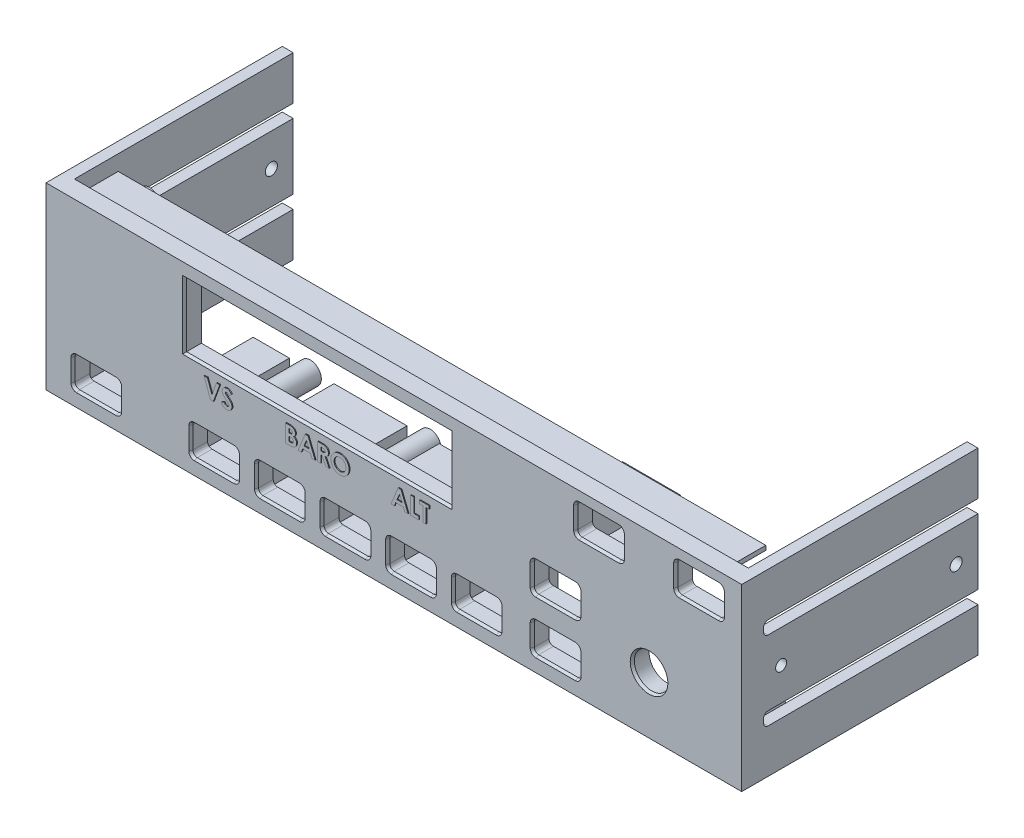
from build123d import *

# Parameters (mm, degrees)
ESQUISSE1_W             = 160
ESQUISSE1_H             = 41
BOSS_EXTRU_1_DEPTH      = 4
ESQUISSE2_R             = 4
ENL_V_MAT_EXTRU_1_DEPTH = 4
ESQUISSE4_W             = 3
ESQUISSE4_H             = 41
BOSS_EXTRU_2_DEPTH      = 50
ENL_V_MAT_EXTRU_2_DEPTH = 173.571724219
CHANFREIN1_SIZE         = 0.3
CHANFREIN1_SIZE2        = 0.643352076
ESQUISSE9_R             = 1.25
ESQUISSE9_R_2           = 1.375
ENL_V_MAT_EXTRU_3_DEPTH = 900
ESQUISSE10_W            = 4.171279912
ESQUISSE10_H            = 57.921201065
ESQUISSE10_W_2          = 8.342559824
ESQUISSE10_H_2          = 64.595248924
ENL_V_MAT_EXTRU_5_DEPTH = 174.772840225
ESQUISSE11_W            = 13.2
ESQUISSE11_H            = 12.9
ESQUISSE11_W_2          = 11.8
ESQUISSE11_H_2          = 11.5
BOSS_EXTRU_4_DEPTH      = 8
ESQUISSE7_R             = 2.5
ESQUISSE7_R_2           = 1.25
BOSS_EXTRU_3_DEPTH      = 11
ESQUISSE12_W            = 148
ESQUISSE12_H            = 1
BOSS_EXTRU_5_DEPTH      = 7
ENL_V_MAT_EXTRU_6_DEPTH = 0.2
BOSS_EXTRU_6_DEPTH      = 0.2
BOSS_EXTRU_6_2_DEPTH    = 0.2
BOSS_EXTRU_6_3_DEPTH    = 0.2
BOSS_EXTRU_6_4_DEPTH    = 0.2
BOSS_EXTRU_6_5_DEPTH    = 0.2
BOSS_EXTRU_6_6_DEPTH    = 0.2
BOSS_EXTRU_6_7_DEPTH    = 0.2
BOSS_EXTRU_6_8_DEPTH    = 0.2
BOSS_EXTRU_6_9_DEPTH    = 0.2
ESQUISSE14_W            = 8.279282425
ESQUISSE14_H            = 6.197970863
ESQUISSE14_W_2          = 6.879282425
ESQUISSE14_H_2          = 4.797970863
ESQUISSE14_W_3          = 16.678738338
ESQUISSE14_H_3          = 6.241410903
ESQUISSE14_W_4          = 15.278738338
ESQUISSE14_H_4          = 4.841410903
ESQUISSE14_W_5          = 11.14782764
ESQUISSE14_H_5          = 6.395979727
ESQUISSE14_W_6          = 9.74782764
ESQUISSE14_H_6          = 4.995979727
BOSS_EXTRU_7_DEPTH      = 8


with BuildPart() as part:
    # Esquisse1 → Boss.-Extru.1 (new body)
    with BuildSketch(Plane.XY):
        with Locations((80, 20.5)):
            Rectangle(ESQUISSE1_W, ESQUISSE1_H)
    extrude(amount=BOSS_EXTRU_1_DEPTH)

    # Esquisse2 → Enlèv. mat.-Extru.1 (cut)
    with BuildSketch(Plane.XY.offset(4)):
        with Locations((138.32, 13)):
            Circle(ESQUISSE2_R)
        with BuildLine():
            Line((7.5, 3.25), (16.5, 3.25))
            ThreePointArc((16.5, 3.25), (17.207106781, 3.542893219), (17.5, 4.25))
            Line((17.5, 4.25), (17.5, 9.25))
            ThreePointArc((17.5, 9.25), (17.207106781, 9.957106781), (16.5, 10.25))
            Line((16.5, 10.25), (7.5, 10.25))
            ThreePointArc((7.5, 10.25), (6.792893219, 9.957106781), (6.5, 9.25))
            Line((6.5, 9.25), (6.5, 4.25))
            ThreePointArc((6.5, 4.25), (6.792893219, 3.542893219), (7.5, 3.25))
        make_face()
        with BuildLine():
            Line((49.430194036, 10.25), (58.430194036, 10.25))
            ThreePointArc((58.430194036, 10.25), (59.137300817, 9.957106781), (59.430194036, 9.25))
            Line((59.430194036, 9.25), (59.430194036, 4.25))
            ThreePointArc((59.430194036, 4.25), (59.137300817, 3.542893219), (58.430194036, 3.25))
            Line((58.430194036, 3.25), (49.430194036, 3.25))
            ThreePointArc((49.430194036, 3.25), (48.723087255, 3.542893219), (48.430194036, 4.25))
            Line((48.430194036, 4.25), (48.430194036, 9.25))
            ThreePointArc((48.430194036, 9.25), (48.723087255, 9.957106781), (49.430194036, 10.25))
        make_face()
        with BuildLine():
            Line((34.430194036, 10.25), (43.430194036, 10.25))
            ThreePointArc((43.430194036, 10.25), (44.137300817, 9.957106781), (44.430194036, 9.25))
            Line((44.430194036, 9.25), (44.430194036, 4.25))
            ThreePointArc((44.430194036, 4.25), (44.137300817, 3.542893219), (43.430194036, 3.25))
            Line((43.430194036, 3.25), (34.430194036, 3.25))
            ThreePointArc((34.430194036, 3.25), (33.723087255, 3.542893219), (33.430194036, 4.25))
            Line((33.430194036, 4.25), (33.430194036, 9.25))
            ThreePointArc((33.430194036, 9.25), (33.723087255, 9.957106781), (34.430194036, 10.25))
        make_face()
        with BuildLine():
            Line((64.430194036, 10.25), (73.430194036, 10.25))
            ThreePointArc((73.430194036, 10.25), (74.137300817, 9.957106781), (74.430194036, 9.25))
            Line((74.430194036, 9.25), (74.430194036, 4.25))
            ThreePointArc((74.430194036, 4.25), (74.137300817, 3.542893219), (73.430194036, 3.25))
            Line((73.430194036, 3.25), (64.430194036, 3.25))
            ThreePointArc((64.430194036, 3.25), (63.723087255, 3.542893219), (63.430194036, 4.25))
            Line((63.430194036, 4.25), (63.430194036, 9.25))
            ThreePointArc((63.430194036, 9.25), (63.723087255, 9.957106781), (64.430194036, 10.25))
        make_face()
        with BuildLine():
            Line((79.430194036, 10.25), (88.430194036, 10.25))
            ThreePointArc((88.430194036, 10.25), (89.137300817, 9.957106781), (89.430194036, 9.25))
            Line((89.430194036, 9.25), (89.430194036, 4.25))
            ThreePointArc((89.430194036, 4.25), (89.137300817, 3.542893219), (88.430194036, 3.25))
            Line((88.430194036, 3.25), (79.430194036, 3.25))
            ThreePointArc((79.430194036, 3.25), (78.723087255, 3.542893219), (78.430194036, 4.25))
            Line((78.430194036, 4.25), (78.430194036, 9.25))
            ThreePointArc((78.430194036, 9.25), (78.723087255, 9.957106781), (79.430194036, 10.25))
        make_face()
        with BuildLine():
            Line((112.45409437, 10.25), (121.45409437, 10.25))
            ThreePointArc((121.45409437, 10.25), (122.161201151, 9.957106781), (122.45409437, 9.25))
            Line((122.45409437, 9.25), (122.45409437, 4.25))
            ThreePointArc((122.45409437, 4.25), (122.161201151, 3.542893219), (121.45409437, 3.25))
            Line((121.45409437, 3.25), (112.45409437, 3.25))
            ThreePointArc((112.45409437, 3.25), (111.746987589, 3.542893219), (111.45409437, 4.25))
            Line((111.45409437, 4.25), (111.45409437, 9.25))
            ThreePointArc((111.45409437, 9.25), (111.746987589, 9.957106781), (112.45409437, 10.25))
        make_face()
        with BuildLine():
            Line((122.389585492, 31.5), (131.389585492, 31.5))
            ThreePointArc((131.389585492, 31.5), (132.096692273, 31.792893219), (132.389585492, 32.5))
            Line((132.389585492, 32.5), (132.389585492, 37.5))
            ThreePointArc((132.389585492, 37.5), (132.096692273, 38.207106781), (131.389585492, 38.5))
            Line((131.389585492, 38.5), (122.389585492, 38.5))
            ThreePointArc((122.389585492, 38.5), (121.682478711, 38.207106781), (121.389585492, 37.5))
            Line((121.389585492, 37.5), (121.389585492, 32.5))
            ThreePointArc((121.389585492, 32.5), (121.682478711, 31.792893219), (122.389585492, 31.5))
        make_face()
        with BuildLine():
            Line((145.25, 31.5), (154.25, 31.5))
            ThreePointArc((154.25, 31.5), (154.957106781, 31.792893219), (155.25, 32.5))
            Line((155.25, 32.5), (155.25, 37.5))
            ThreePointArc((155.25, 37.5), (154.957106781, 38.207106781), (154.25, 38.5))
            Line((154.25, 38.5), (145.25, 38.5))
            ThreePointArc((145.25, 38.5), (144.542893219, 38.207106781), (144.25, 37.5))
            Line((144.25, 37.5), (144.25, 32.5))
            ThreePointArc((144.25, 32.5), (144.542893219, 31.792893219), (145.25, 31.5))
        make_face()
        with BuildLine():
            Line((112.45409437, 22.25), (121.45409437, 22.25))
            ThreePointArc((121.45409437, 22.25), (122.161201151, 21.957106781), (122.45409437, 21.25))
            Line((122.45409437, 21.25), (122.45409437, 16.25))
            ThreePointArc((122.45409437, 16.25), (122.161201151, 15.542893219), (121.45409437, 15.25))
            Line((121.45409437, 15.25), (112.45409437, 15.25))
            ThreePointArc((112.45409437, 15.25), (111.746987589, 15.542893219), (111.45409437, 16.25))
            Line((111.45409437, 16.25), (111.45409437, 21.25))
            ThreePointArc((111.45409437, 21.25), (111.746987589, 21.957106781), (112.45409437, 22.25))
        make_face()
        Polygon((32, 38), (63.5, 38), (93, 38), (93, 23), (63.5, 23), (32, 23), align=None)
        with BuildLine():
            Line((94.430194036, 10.25), (103.430194036, 10.25))
            ThreePointArc((103.430194036, 10.25), (104.137300817, 9.957106781), (104.430194036, 9.25))
            Line((104.430194036, 9.25), (104.430194036, 4.25))
            ThreePointArc((104.430194036, 4.25), (104.137300817, 3.542893219), (103.430194036, 3.25))
            Line((103.430194036, 3.25), (94.430194036, 3.25))
            ThreePointArc((94.430194036, 3.25), (93.723087255, 3.542893219), (93.430194036, 4.25))
            Line((93.430194036, 4.25), (93.430194036, 9.25))
            ThreePointArc((93.430194036, 9.25), (93.723087255, 9.957106781), (94.430194036, 10.25))
        make_face()
    extrude(amount=-ENL_V_MAT_EXTRU_1_DEPTH, mode=Mode.SUBTRACT)

    # Esquisse4 → Boss.-Extru.2 (add)
    with BuildSketch(Plane(origin=(0, 0, 0), x_dir=(-1, 0, 0), z_dir=(0, 0, -1))):
        with Locations((-158.5, 20.5)):
            Rectangle(ESQUISSE4_W, ESQUISSE4_H)
        with Locations((-1.5, 20.5)):
            Rectangle(ESQUISSE4_W, ESQUISSE4_H)
    extrude(amount=BOSS_EXTRU_2_DEPTH)

    # Esquisse5 → Enlèv. mat.-Extru.2 (cut, through all)
    with BuildSketch(Plane(origin=(160, 0, 0), x_dir=(0, 0, -1), z_dir=(1, 0, 0))):
        with BuildLine():
            Line((50, 13), (2, 13))
            ThreePointArc((2, 13), (1.292893219, 12.707106781), (1, 12))
            Line((1, 12), (1, 11))
            ThreePointArc((1, 11), (1.292893219, 10.292893219), (2, 10))
            Line((2, 10), (50, 10))
            Line((50, 10), (50, 13))
        make_face()
        with BuildLine():
            Line((50, 31), (2, 31))
            ThreePointArc((2, 31), (1.292893219, 30.707106781), (1, 30))
            Line((1, 30), (1, 29))
            ThreePointArc((1, 29), (1.292893219, 28.292893219), (2, 28))
            Line((2, 28), (50, 28))
            Line((50, 28), (50, 31))
        make_face()
    extrude(amount=-ENL_V_MAT_EXTRU_2_DEPTH, mode=Mode.SUBTRACT)

    # Chanfrein1
    chanfrein1_edges = [part.edges().sort_by_distance(p)[0] for p in [
        (93, 30.5, 4),
        (62.5, 23, 4),
        (32, 30.5, 4),
        (62.5, 38, 4),
        (149.75, 31.5, 4),
        (154.957106781, 31.792893219, 4),
        (144.542893219, 31.792893219, 4),
        (155.25, 35, 4),
        (144.25, 35, 4),
        (154.957106781, 38.207106781, 4),
        (144.542893219, 38.207106781, 4),
        (149.75, 38.5, 4),
        (126.889585492, 31.5, 4),
        (132.096692273, 31.792893219, 4),
        (121.682478711, 31.792893219, 4),
        (132.389585492, 35, 4),
        (121.389585492, 35, 4),
        (132.096692273, 38.207106781, 4),
        (121.682478711, 38.207106781, 4),
        (126.889585492, 38.5, 4),
        (12, 3.25, 4),
        (17.207106781, 3.542893219, 4),
        (6.792893219, 3.542893219, 4),
        (17.5, 6.75, 4),
        (6.5, 6.75, 4),
        (17.207106781, 9.957106781, 4),
        (6.792893219, 9.957106781, 4),
        (12, 10.25, 4),
        (134.32, 13, 4),
        (122.45409437, 18.75, 4),
        (122.161201151, 21.957106781, 4),
        (122.161201151, 15.542893219, 4),
        (116.95409437, 22.25, 4),
        (116.95409437, 15.25, 4),
        (111.746987589, 21.957106781, 4),
        (111.746987589, 15.542893219, 4),
        (111.45409437, 18.75, 4),
        (122.45409437, 6.75, 4),
        (122.161201151, 9.957106781, 4),
        (122.161201151, 3.542893219, 4),
        (116.95409437, 10.25, 4),
        (116.95409437, 3.25, 4),
        (111.746987589, 9.957106781, 4),
        (111.746987589, 3.542893219, 4),
        (111.45409437, 6.75, 4),
        (104.430194036, 6.75, 4),
        (104.137300817, 9.957106781, 4),
        (104.137300817, 3.542893219, 4),
        (98.930194036, 10.25, 4),
        (98.930194036, 3.25, 4),
        (93.723087255, 9.957106781, 4),
        (93.723087255, 3.542893219, 4),
        (93.430194036, 6.75, 4),
        (89.430194036, 6.75, 4),
        (89.137300817, 9.957106781, 4),
        (89.137300817, 3.542893219, 4),
        (83.930194036, 10.25, 4),
        (83.930194036, 3.25, 4),
        (78.723087255, 9.957106781, 4),
        (78.723087255, 3.542893219, 4),
        (78.430194036, 6.75, 4),
        (74.430194036, 6.75, 4),
        (74.137300817, 9.957106781, 4),
        (74.137300817, 3.542893219, 4),
        (68.930194036, 10.25, 4),
        (68.930194036, 3.25, 4),
        (63.723087255, 9.957106781, 4),
        (63.723087255, 3.542893219, 4),
        (63.430194036, 6.75, 4),
        (59.430194036, 6.75, 4),
        (59.137300817, 9.957106781, 4),
        (59.137300817, 3.542893219, 4),
        (53.930194036, 10.25, 4),
        (53.930194036, 3.25, 4),
        (48.723087255, 9.957106781, 4),
        (48.723087255, 3.542893219, 4),
        (48.430194036, 6.75, 4),
        (44.430194036, 6.75, 4),
        (44.137300817, 9.957106781, 4),
        (44.137300817, 3.542893219, 4),
        (38.930194036, 10.25, 4),
        (38.930194036, 3.25, 4),
        (33.723087255, 9.957106781, 4),
        (33.723087255, 3.542893219, 4),
        (33.430194036, 6.75, 4),
    ]]
    chanfrein1_side = [part.faces().sort_by_distance(p)[0] for p in [
        (81.647811434, 19.771879368, 4),
    ]]
    chamfer(chanfrein1_edges, length=CHANFREIN1_SIZE, length2=CHANFREIN1_SIZE2, reference=chanfrein1_side[0])

    # Esquisse9 → Enlèv. mat.-Extru.3 (cut)
    with BuildSketch(Plane(origin=(160, 0, 0), x_dir=(0, 0, -1), z_dir=(1, 0, 0))):
        with Locations((5, 20.5)):
            Circle(ESQUISSE9_R)
        with Locations((45, 20.5)):
            Circle(ESQUISSE9_R_2)
    extrude(amount=-ENL_V_MAT_EXTRU_3_DEPTH, mode=Mode.SUBTRACT)

    # Esquisse10 → Enlèv. mat.-Extru.5 (cut, through all)
    with BuildSketch(Plane.XY.offset(4)):
        with Locations((-1.585639956, 24.108169502)):
            Rectangle(ESQUISSE10_W, ESQUISSE10_H)
        with Locations((163.671279912, 22.797195815)):
            Rectangle(ESQUISSE10_W_2, ESQUISSE10_H_2)
    extrude(amount=-ENL_V_MAT_EXTRU_5_DEPTH, mode=Mode.SUBTRACT)

    # Esquisse11 → Boss.-Extru.4 (add)
    # profile 1 of 7: a face of its own
    with BuildSketch(Plane(origin=(0, 0, 0), x_dir=(-1, 0, 0), z_dir=(0, 0, -1))):
        with Locations((-12, 8.5)):
            Rectangle(ESQUISSE11_W, ESQUISSE11_H)
        with Locations((-12, 8.5)):
            Rectangle(ESQUISSE11_W_2, ESQUISSE11_H_2, mode=Mode.SUBTRACT)
    # profile 2 of 7: a face of its own
    with BuildSketch(Plane(origin=(0, 0, 0), x_dir=(-1, 0, 0), z_dir=(0, 0, -1))):
        with Locations((-38.930194036, 8.5)):
            Rectangle(ESQUISSE11_W, ESQUISSE11_H)
        with Locations((-38.930194036, 8.5)):
            Rectangle(ESQUISSE11_W_2, ESQUISSE11_H_2, mode=Mode.SUBTRACT)
    # profile 3 of 7: a face of its own
    with BuildSketch(Plane(origin=(0, 0, 0), x_dir=(-1, 0, 0), z_dir=(0, 0, -1))):
        with Locations((-53.930194036, 8.5)):
            Rectangle(ESQUISSE11_W, ESQUISSE11_H)
        with Locations((-53.930194036, 8.5)):
            Rectangle(ESQUISSE11_W_2, ESQUISSE11_H_2, mode=Mode.SUBTRACT)
    # profile 4 of 7: a face of its own
    with BuildSketch(Plane(origin=(0, 0, 0), x_dir=(-1, 0, 0), z_dir=(0, 0, -1))):
        with Locations((-68.930194036, 8.5)):
            Rectangle(ESQUISSE11_W, ESQUISSE11_H)
        with Locations((-68.930194036, 8.5)):
            Rectangle(ESQUISSE11_W_2, ESQUISSE11_H_2, mode=Mode.SUBTRACT)
    # profile 5 of 7: a face of its own
    with BuildSketch(Plane(origin=(0, 0, 0), x_dir=(-1, 0, 0), z_dir=(0, 0, -1))):
        with Locations((-83.930194036, 8.5)):
            Rectangle(ESQUISSE11_W, ESQUISSE11_H)
        with Locations((-83.930194036, 8.5)):
            Rectangle(ESQUISSE11_W_2, ESQUISSE11_H_2, mode=Mode.SUBTRACT)
    # profile 6 of 7: a face of its own
    with BuildSketch(Plane(origin=(0, 0, 0), x_dir=(-1, 0, 0), z_dir=(0, 0, -1))):
        with Locations((-98.930194036, 8.5)):
            Rectangle(ESQUISSE11_W, ESQUISSE11_H)
        with Locations((-98.930194036, 8.5)):
            Rectangle(ESQUISSE11_W_2, ESQUISSE11_H_2, mode=Mode.SUBTRACT)
    # profile 7 of 7: a face of its own
    with BuildSketch(Plane(origin=(0, 0, 0), x_dir=(-1, 0, 0), z_dir=(0, 0, -1))):
        with Locations((-126.889585492, 33.25)):
            Rectangle(ESQUISSE11_W, ESQUISSE11_H)
        with Locations((-126.889585492, 33.25)):
            Rectangle(ESQUISSE11_W_2, ESQUISSE11_H_2, mode=Mode.SUBTRACT)
    extrude(amount=BOSS_EXTRU_4_DEPTH)

    # Esquisse7 → Boss.-Extru.3 (add)
    # profile 1 of 7: a face of its own
    with BuildSketch(Plane(origin=(0, 0, 0), x_dir=(-1, 0, 0), z_dir=(0, 0, -1))):
        with Locations((-9.121504758, 34.424873109)):
            Circle(ESQUISSE7_R)
        with Locations((-9.121504758, 34.424873109)):
            Circle(ESQUISSE7_R_2, mode=Mode.SUBTRACT)
    # profile 2 of 7: a face of its own
    with BuildSketch(Plane(origin=(0, 0, 0), x_dir=(-1, 0, 0), z_dir=(0, 0, -1))):
        with Locations((-24.98168427, 6.75)):
            Circle(ESQUISSE7_R)
        with Locations((-24.98168427, 6.75)):
            Circle(ESQUISSE7_R_2, mode=Mode.SUBTRACT)
    # profile 3 of 7: a face of its own
    with BuildSketch(Plane(origin=(0, 0, 0), x_dir=(-1, 0, 0), z_dir=(0, 0, -1))):
        with Locations((-138.246159037, 33.067084724)):
            Circle(ESQUISSE7_R)
        with Locations((-138.246159037, 33.067084724)):
            Circle(ESQUISSE7_R_2, mode=Mode.SUBTRACT)
    # profile 4 of 7: a face of its own
    with BuildSketch(Plane(origin=(0, 0, 0), x_dir=(-1, 0, 0), z_dir=(0, 0, -1))):
        with Locations((-152.183195484, 6.75)):
            Circle(ESQUISSE7_R)
        with Locations((-152.183195484, 6.75)):
            Circle(ESQUISSE7_R_2, mode=Mode.SUBTRACT)
    # profile 5 of 7: a face of its own
    with BuildSketch(Plane(origin=(0, 0, 0), x_dir=(-1, 0, 0), z_dir=(0, 0, -1))):
        with Locations((-73.299586821, 18.635920155)):
            Circle(ESQUISSE7_R)
        with Locations((-73.299586821, 18.635920155)):
            Circle(ESQUISSE7_R_2, mode=Mode.SUBTRACT)
    # profile 6 of 7: a face of its own
    with BuildSketch(Plane(origin=(0, 0, 0), x_dir=(-1, 0, 0), z_dir=(0, 0, -1))):
        with Locations((-103.528260194, 18.635920155)):
            Circle(ESQUISSE7_R)
        with Locations((-103.528260194, 18.635920155)):
            Circle(ESQUISSE7_R_2, mode=Mode.SUBTRACT)
    # profile 7 of 7: a face of its own
    with BuildSketch(Plane(origin=(0, 0, 0), x_dir=(-1, 0, 0), z_dir=(0, 0, -1))):
        with Locations((-45.928753513, 18.635920155)):
            Circle(ESQUISSE7_R)
        with Locations((-45.928753513, 18.635920155)):
            Circle(ESQUISSE7_R_2, mode=Mode.SUBTRACT)
    extrude(amount=BOSS_EXTRU_3_DEPTH)

    # Esquisse12 → Boss.-Extru.5 (add)
    with BuildSketch(Plane(origin=(0, 0, 0), x_dir=(-1, 0, 0), z_dir=(0, 0, -1))):
        with Locations((-80, 40)):
            Rectangle(ESQUISSE12_W, ESQUISSE12_H)
        with Locations((-80, 1)):
            Rectangle(ESQUISSE12_W, ESQUISSE12_H)
    extrude(amount=BOSS_EXTRU_5_DEPTH)

    # Esquisse13 → Enlèv. mat.-Extru.6 (cut)
    # profile 1 of 9: a face of its own
    with BuildSketch(Plane.XY.offset(4)):
        Polygon((36.828205128, 21.061183811), (37.595032051, 21.061183811), (38.623076923, 18.219837658), (39.653525641, 21.061183811), (40.417948718, 21.061183811), (38.967628205, 17.061183811), (38.276121795, 17.061183811), align=None)
    # profile 2 of 9: a face of its own
    with BuildSketch(Plane.XY.offset(4)):
        with BuildLine():
            Line((43.11025641, 20.526728683), (42.573397436, 20.035542786))
            add(Edge.make_bspline(
                [(42.573397436, 20.035542786), (42.550400699, 20.067982073), (42.506250172, 20.130260982), (42.434686773, 20.213653908), (42.363446519, 20.28479428), (42.291869413, 20.343384906), (42.219321023, 20.389069805), (42.145927282, 20.421415218), (42.072104279, 20.441977504), (42.022506616, 20.444538003), (41.998076923, 20.445799196)],
                knots=[0, 0, 0, 0, 1.299362458, 2.494594718, 3.587462134, 4.587049575, 5.512617175, 6.380583204, 7.202344345, 8, 8, 8, 8], degree=3))
            add(Edge.make_bspline(
                [(41.998076923, 20.445799196), (41.975289606, 20.445000046), (41.931293283, 20.443457099), (41.868573261, 20.428120311), (41.812889533, 20.401651269), (41.764296442, 20.367040768), (41.725803545, 20.32534314), (41.695069952, 20.281613049), (41.677764356, 20.233344918), (41.675486599, 20.200192419), (41.674358974, 20.183779965)],
                knots=[0, 0, 0, 0, 1.185010067, 2.2879431, 3.333075148, 4.379039566, 5.372662701, 6.27520591, 7.14612461, 8, 8, 8, 8], degree=3))
            add(Edge.make_bspline(
                [(41.674358974, 20.183779965), (41.6750656, 20.167130837), (41.676488645, 20.133601805), (41.690233323, 20.084460834), (41.710950479, 20.036444385), (41.730746567, 20.007214488), (41.740865385, 19.992273555)],
                knots=[0, 0, 0, 0, 0.967525499, 1.948461899, 2.951351359, 4, 4, 4, 4], degree=3))
            add(Edge.make_bspline(
                [(41.740865385, 19.992273555), (41.750064485, 19.980660125), (41.771239598, 19.953927541), (41.811616203, 19.911587297), (41.862320739, 19.859716791), (41.925304423, 19.800099698), (41.997952629, 19.730591956), (42.083632696, 19.653925939), (42.179878378, 19.567727389), (42.248287579, 19.507701841), (42.284134615, 19.476247914)],
                knots=[0, 0, 0, 0, 0.473873513, 1.090794244, 1.870441696, 2.795289791, 3.865433203, 5.087734844, 6.473946851, 8, 8, 8, 8], degree=3))
            add(Edge.make_bspline(
                [(42.284134615, 19.476247914), (42.317782216, 19.447127613), (42.381638371, 19.391863331), (42.472492999, 19.313424557), (42.552339086, 19.242855104), (42.622339806, 19.18121407), (42.681434017, 19.127854698), (42.729870152, 19.082521931), (42.768239774, 19.046098316), (42.790050658, 19.02409843), (42.799358974, 19.014709452)],
                knots=[0, 0, 0, 0, 1.543621617, 2.929473131, 4.163658386, 5.240097082, 6.164993805, 6.925417477, 7.541396219, 8, 8, 8, 8], degree=3))
            add(Edge.make_bspline(
                [(42.799358974, 19.014709452), (42.834672785, 18.976492346), (42.902558331, 18.903025646), (42.99078561, 18.789175366), (43.063399514, 18.678034279), (43.119575007, 18.567511083), (43.162000999, 18.45601115), (43.191911886, 18.34079995), (43.209825715, 18.220673598), (43.211814568, 18.138702028), (43.212820513, 18.097241504)],
                knots=[0, 0, 0, 0, 1.206664779, 2.319633467, 3.337109185, 4.282041471, 5.190008762, 6.099243693, 7.03861361, 8, 8, 8, 8], degree=3))
            add(Edge.make_bspline(
                [(43.212820513, 18.097241504), (43.212104507, 18.056843308), (43.210699677, 17.977580544), (43.193493199, 17.861591295), (43.168957772, 17.750584551), (43.131021698, 17.64576822), (43.084785436, 17.545421775), (43.026821603, 17.451108295), (42.95875103, 17.361873288), (42.880731701, 17.279311939), (42.794433059, 17.204393238), (42.701869563, 17.13769884), (42.602136082, 17.08263412), (42.496084722, 17.03729225), (42.383772251, 17.002369336), (42.265332466, 16.976558048), (42.140584206, 16.961066519), (42.055279548, 16.959447064), (42.011698718, 16.958619709)],
                knots=[0, 0, 0, 0, 1.043214005, 2.046824704, 3.02475056, 3.976699089, 4.921714032, 5.875962561, 6.831408892, 7.817874052, 8.806269674, 9.781291748, 10.760897367, 11.74438705, 12.757449933, 13.795994037, 14.874007457, 16, 16, 16, 16], degree=3))
            add(Edge.make_bspline(
                [(42.011698718, 16.958619709), (41.977488138, 16.959226627), (41.909731569, 16.960428674), (41.80986863, 16.970242385), (41.713439674, 16.986080669), (41.620553319, 17.008781662), (41.530791095, 17.0375469), (41.444149317, 17.072682535), (41.361226101, 17.114733158), (41.281394011, 17.16283404), (41.205041129, 17.2186855), (41.131202003, 17.281145673), (41.060610074, 17.351175225), (40.992926303, 17.428608538), (40.928583749, 17.513664885), (40.865476249, 17.6051597), (40.806408492, 17.704791), (40.769919711, 17.774683164), (40.751282051, 17.810382529)],
                knots=[0, 0, 0, 0, 1.016823716, 2.013894106, 2.979844003, 3.91962641, 4.853723003, 5.779685073, 6.695824784, 7.614987388, 8.547259901, 9.504950863, 10.487499108, 11.500346958, 12.559593716, 13.656357062, 14.802919212, 16, 16, 16, 16], degree=3))
            Line((40.751282051, 17.810382529), (41.382692308, 18.18938894))
            add(Edge.make_bspline(
                [(41.382692308, 18.18938894), (41.406005234, 18.148865495), (41.450698107, 18.071178589), (41.526434357, 17.966796385), (41.604022279, 17.877410305), (41.685255637, 17.804600254), (41.769146661, 17.74739267), (41.856100567, 17.706508161), (41.946178446, 17.681200696), (42.007535405, 17.67811007), (42.038141026, 17.676568427)],
                knots=[0, 0, 0, 0, 1.283663364, 2.460892379, 3.537111102, 4.529833553, 5.449777664, 6.316464042, 7.160231139, 8, 8, 8, 8], degree=3))
            add(Edge.make_bspline(
                [(42.038141026, 17.676568427), (42.069271324, 17.677827416), (42.129668636, 17.680270039), (42.215878071, 17.702831807), (42.294918145, 17.738255438), (42.363239801, 17.788800075), (42.421090272, 17.847136268), (42.46378724, 17.91203795), (42.490609763, 17.982260004), (42.493445554, 18.031040861), (42.494871795, 18.055574837)],
                knots=[0, 0, 0, 0, 1.13588714, 2.203786484, 3.234766741, 4.283437687, 5.291419208, 6.222934724, 7.106237994, 8, 8, 8, 8], degree=3))
            add(Edge.make_bspline(
                [(42.494871795, 18.055574837), (42.49355472, 18.078399709), (42.490879209, 18.124766252), (42.47117222, 18.193705846), (42.440364184, 18.262614088), (42.403916106, 18.319134491), (42.366825622, 18.366457493), (42.331358753, 18.407460734), (42.28816949, 18.452762137), (42.23736734, 18.502418687), (42.179623533, 18.556867524), (42.114889427, 18.616103316), (42.042423748, 18.679604266), (41.991204863, 18.722860486), (41.964423077, 18.745478683)],
                knots=[0, 0, 0, 0, 0.916159276, 1.861089862, 2.860218735, 3.940849679, 4.552606315, 5.27541173, 6.11797699, 7.06649574, 8.129236253, 9.306560635, 10.591630461, 12, 12, 12, 12], degree=3))
            add(Edge.make_bspline(
                [(41.964423077, 18.745478683), (41.913509835, 18.788556168), (41.815791914, 18.871234899), (41.677704094, 18.993348783), (41.553274605, 19.107475396), (41.443578151, 19.215025594), (41.347217032, 19.314013173), (41.264843846, 19.405242148), (41.197363501, 19.489416227), (41.126354988, 19.58911479), (41.058882704, 19.71060434), (41.000567503, 19.856770351), (40.962735063, 20.002917817), (40.958496464, 20.101033176), (40.956410256, 20.149324837)],
                knots=[0, 0, 0, 0, 1.345494975, 2.582412109, 3.71882943, 4.751509156, 5.681369928, 6.505683931, 7.230279997, 7.856715994, 8.973648664, 10.023341002, 11.027102913, 12, 12, 12, 12], degree=3))
            add(Edge.make_bspline(
                [(40.956410256, 20.149324837), (40.957277907, 20.183570691), (40.958987273, 20.251038703), (40.974235075, 20.350240583), (40.997023497, 20.445962062), (41.030118828, 20.537853905), (41.073072572, 20.625801012), (41.125238225, 20.710233923), (41.187425822, 20.790375536), (41.257507045, 20.866172722), (41.33471861, 20.935442725), (41.417228979, 20.996580443), (41.504571137, 21.048218248), (41.596210768, 21.091055558), (41.692715724, 21.123844797), (41.79337506, 21.147087444), (41.898333151, 21.160911429), (41.969723379, 21.162790639), (42.006089744, 21.163747914)],
                knots=[0, 0, 0, 0, 1.010766082, 1.991317756, 2.957454644, 3.913069143, 4.869106762, 5.843196583, 6.838735724, 7.860187025, 8.887984031, 9.89767229, 10.887916223, 11.879572884, 12.879850636, 13.892031539, 14.926195476, 16, 16, 16, 16], degree=3))
            add(Edge.make_bspline(
                [(42.006089744, 21.163747914), (42.053218752, 21.162023834), (42.14710475, 21.158589285), (42.285917905, 21.131732227), (42.421504791, 21.089496676), (42.530763245, 21.03854413), (42.617698158, 20.989186374), (42.684325647, 20.94374397), (42.752122704, 20.891687254), (42.82163607, 20.832852182), (42.891574078, 20.766130222), (42.9639254, 20.693109745), (43.037704163, 20.613159683), (43.08564866, 20.556043729), (43.11025641, 20.526728683)],
                knots=[0, 0, 0, 0, 1.282922637, 2.555718331, 3.837320111, 5.142675274, 5.830281639, 6.55870424, 7.337177975, 8.157850921, 9.037902056, 9.96903443, 10.957596896, 12, 12, 12, 12], degree=3))
        make_face()
    # profile 3 of 9: a face of its own
    with BuildSketch(Plane.XY.offset(4)):
        with BuildLine():
            Line((55.461538462, 17.061183811), (55.461538462, 21.061183811))
            Line((55.461538462, 21.061183811), (56.102564103, 21.061183811))
            add(Edge.make_bspline(
                [(56.102564103, 21.061183811), (56.147439906, 21.061188933), (56.234273734, 21.061198843), (56.359552286, 21.056799471), (56.475737563, 21.051108391), (56.582459819, 21.044741397), (56.679900701, 21.033769792), (56.767912036, 21.02220692), (56.84666967, 21.008262808), (56.895361235, 20.995754508), (56.918269231, 20.989869709)],
                knots=[0, 0, 0, 0, 1.311965854, 2.538629056, 3.664479157, 4.713267157, 5.663616078, 6.530575999, 7.308677837, 8, 8, 8, 8], degree=3))
            add(Edge.make_bspline(
                [(56.918269231, 20.989869709), (56.948349755, 20.981569095), (57.007377399, 20.965280625), (57.091923823, 20.932385358), (57.1721279, 20.895819935), (57.247891703, 20.854105627), (57.318750011, 20.806738824), (57.38443354, 20.75334361), (57.446358919, 20.696063266), (57.502327322, 20.633301405), (57.552913536, 20.566981873), (57.596863886, 20.497122047), (57.635051108, 20.42479013), (57.665610887, 20.349075873), (57.688637107, 20.27032796), (57.705478388, 20.188882657), (57.716393819, 20.104482251), (57.717425184, 20.047061897), (57.717948718, 20.017914581)],
                knots=[0, 0, 0, 0, 1.099996261, 2.158545794, 3.195537121, 4.207578794, 5.205712374, 6.197378256, 7.190519799, 8.17788031, 9.159561366, 10.129234751, 11.085776129, 12.040971148, 13.00380137, 13.975669004, 14.972423361, 16, 16, 16, 16], degree=3))
            add(Edge.make_bspline(
                [(57.717948718, 20.017914581), (57.716579831, 19.98046793), (57.713885346, 19.9067588), (57.696672793, 19.798493424), (57.664396574, 19.696167082), (57.622163926, 19.597893938), (57.564740728, 19.504040552), (57.491824373, 19.414651549), (57.404595866, 19.326974508), (57.337686786, 19.274418035), (57.302884615, 19.247081247)],
                knots=[0, 0, 0, 0, 0.986156485, 1.941127874, 2.875419072, 3.804401753, 4.751181392, 5.761612777, 6.835722519, 8, 8, 8, 8], degree=3))
            add(Edge.make_bspline(
                [(57.302884615, 19.247081247), (57.331086625, 19.232684366), (57.386382964, 19.204456065), (57.46488752, 19.158057164), (57.537574169, 19.108706048), (57.604768817, 19.057395682), (57.665061978, 19.001950944), (57.720943259, 18.945566638), (57.769655767, 18.885012175), (57.81321596, 18.822445833), (57.851077771, 18.756961644), (57.884051234, 18.688670196), (57.911902735, 18.61733819), (57.935488107, 18.543328649), (57.953078084, 18.466387014), (57.964547122, 18.386485768), (57.973328535, 18.303897415), (57.974011647, 18.247640291), (57.974358974, 18.219036376)],
                knots=[0, 0, 0, 0, 1.164658916, 2.283573913, 3.35186032, 4.395461096, 5.390182219, 6.362969632, 7.312859996, 8.245001507, 9.165155236, 10.092416118, 11.032087915, 11.979892451, 12.947605196, 13.931445124, 14.948243989, 16, 16, 16, 16], degree=3))
            add(Edge.make_bspline(
                [(57.974358974, 18.219036376), (57.972105049, 18.164404533), (57.967656937, 18.056588811), (57.935134514, 17.898290569), (57.878750965, 17.748209479), (57.803039485, 17.606942025), (57.709748376, 17.47857767), (57.602490352, 17.36613161), (57.482345258, 17.270948516), (57.371496886, 17.206707311), (57.275621775, 17.163595456), (57.196210211, 17.136940988), (57.110923875, 17.11224833), (57.018200525, 17.094908635), (56.91972111, 17.079037439), (56.814525449, 17.069238235), (56.702810151, 17.062597555), (56.626079255, 17.061664587), (56.586538462, 17.061183811)],
                knots=[0, 0, 0, 0, 1.284142165, 2.534249414, 3.780121997, 5.041676246, 6.291546858, 7.49970053, 8.684500223, 9.883330709, 10.50184324, 11.153274765, 11.851151195, 12.587658647, 13.369265475, 14.195992086, 15.070362669, 16, 16, 16, 16], degree=3))
            Line((56.586538462, 17.061183811), (55.461538462, 17.061183811))
        make_face()
        with BuildLine():
            Line((56.179487179, 20.343235093), (56.179487179, 19.471440222))
            Line((56.179487179, 19.471440222), (56.370192308, 19.471440222))
            add(Edge.make_bspline(
                [(56.370192308, 19.471440222), (56.396110848, 19.471666241), (56.446145022, 19.472102558), (56.518414078, 19.477722169), (56.585612629, 19.487309573), (56.647485806, 19.500686414), (56.70460998, 19.517673052), (56.756620224, 19.538111636), (56.803287859, 19.563048929), (56.857504858, 19.600194129), (56.914816136, 19.654854952), (56.965266609, 19.733823837), (56.9949816, 19.824637754), (56.998291049, 19.888686761), (57, 19.921760735)],
                knots=[0, 0, 0, 0, 1.065314748, 2.056525647, 2.977365736, 3.853934255, 4.656397591, 5.425096493, 6.14721249, 6.826394842, 8.123232004, 9.372140726, 10.643011755, 12, 12, 12, 12], degree=3))
            add(Edge.make_bspline(
                [(57, 19.921760735), (56.998632526, 19.952740006), (56.995988571, 20.012637183), (56.966069395, 20.096738153), (56.919598999, 20.171268825), (56.864734166, 20.222278975), (56.813068264, 20.257117404), (56.768828748, 20.280057026), (56.720272558, 20.300592341), (56.666459697, 20.316294143), (56.607697466, 20.328076222), (56.544271307, 20.336728749), (56.476071787, 20.342618026), (56.428966234, 20.343024992), (56.404647436, 20.343235093)],
                knots=[0, 0, 0, 0, 1.347982417, 2.606269829, 3.849316587, 5.153353503, 5.842674298, 6.568177932, 7.326619318, 8.142485038, 9.012069166, 9.942760135, 10.937925643, 12, 12, 12, 12], degree=3))
            Line((56.404647436, 20.343235093), (56.179487179, 20.343235093))
        make_face(mode=Mode.SUBTRACT)
        with BuildLine():
            Line((56.179487179, 18.804773555), (56.179487179, 17.779132529))
            Line((56.179487179, 17.779132529), (56.386217949, 17.779132529))
            add(Edge.make_bspline(
                [(56.386217949, 17.779132529), (56.427088885, 17.779366024), (56.50566836, 17.779814945), (56.618233319, 17.785238986), (56.720583008, 17.795014864), (56.812446238, 17.807219259), (56.893963717, 17.823754307), (56.964859895, 17.844776501), (57.026107021, 17.867904576), (57.077337855, 17.896470494), (57.119190512, 17.929714139), (57.156958146, 17.963689943), (57.187751522, 18.002884243), (57.212115816, 18.045614535), (57.233203069, 18.09081937), (57.245921411, 18.140263979), (57.25560471, 18.192482943), (57.256137608, 18.228601671), (57.256410256, 18.247081247)],
                knots=[0, 0, 0, 0, 1.753078804, 3.370512758, 4.83203934, 6.162291463, 7.344201807, 8.395507345, 9.331626367, 10.147333109, 10.898971645, 11.62040215, 12.321813352, 13.025280112, 13.727906689, 14.453419512, 15.208716525, 16, 16, 16, 16], degree=3))
            add(Edge.make_bspline(
                [(57.256410256, 18.247081247), (57.255808988, 18.268212934), (57.254637878, 18.309371774), (57.245073409, 18.369529812), (57.227691645, 18.425691332), (57.205798466, 18.47929246), (57.175332943, 18.528414089), (57.139125711, 18.574756131), (57.095378131, 18.616749303), (57.046181425, 18.656933508), (56.988798338, 18.692116957), (56.923201948, 18.722644831), (56.8490359, 18.748140587), (56.766070456, 18.768440325), (56.67466933, 18.785668431), (56.574165395, 18.795955513), (56.465395682, 18.803606468), (56.389972993, 18.804375686), (56.350961538, 18.804773555)],
                knots=[0, 0, 0, 0, 0.845221588, 1.646264278, 2.427170338, 3.19324141, 3.95557735, 4.731569926, 5.540061037, 6.376114724, 7.268642756, 8.224665384, 9.265483498, 10.400594375, 11.639216012, 12.983232105, 14.439614077, 16, 16, 16, 16], degree=3))
            Line((56.350961538, 18.804773555), (56.179487179, 18.804773555))
        make_face(mode=Mode.SUBTRACT)
    # profile 4 of 9: a face of its own
    with BuildSketch(Plane.XY.offset(4)):
        Polygon((59.923878205, 21.061183811), (60.58974359, 21.061183811), (62.205128205, 17.061183811), (61.438301282, 17.061183811), (61.127403846, 17.881696632), (59.384615385, 17.881696632), (59.073717949, 17.061183811), (58.307692308, 17.061183811), align=None)
        Polygon((60.256410256, 19.988267145), (59.657051282, 18.59964535), (60.855769231, 18.59964535), align=None, mode=Mode.SUBTRACT)
    # profile 5 of 9: a face of its own
    with BuildSketch(Plane.XY.offset(4)):
        with BuildLine():
            Line((62.794871795, 21.061183811), (63.631410256, 21.061183811))
            add(Edge.make_bspline(
                [(63.631410256, 21.061183811), (63.686705194, 21.060987546), (63.793052935, 21.060610073), (63.946400569, 21.054654542), (64.087271459, 21.046366931), (64.215874178, 21.033719818), (64.332153707, 21.016951274), (64.436226586, 20.997183936), (64.528089773, 20.974654817), (64.608518006, 20.946581756), (64.68110051, 20.914915769), (64.748757494, 20.87853097), (64.812981572, 20.837832514), (64.873343477, 20.791749515), (64.930367766, 20.741110996), (64.98416202, 20.685865982), (65.033966075, 20.625546019), (65.079471544, 20.560532254), (65.120946116, 20.492139263), (65.157600939, 20.420273143), (65.187408702, 20.344883917), (65.213747056, 20.26706112), (65.232717719, 20.185692262), (65.245911537, 20.101569481), (65.255571535, 20.014396657), (65.256126939, 19.955175311), (65.256410256, 19.924965863)],
                knots=[0, 0, 0, 0, 1.749336639, 3.364467119, 4.854658419, 6.213483162, 7.451590619, 8.570285859, 9.5643256, 10.440900261, 11.26203566, 12.067320669, 12.869050712, 13.665104639, 14.467235401, 15.27997916, 16.102287765, 16.939272006, 17.78853747, 18.631303466, 19.488103222, 20.351255419, 21.228522269, 22.127379805, 23.044756219, 24, 24, 24, 24], degree=3))
            add(Edge.make_bspline(
                [(65.256410256, 19.924965863), (65.2556743, 19.893434139), (65.254231223, 19.831606175), (65.246458024, 19.740785938), (65.232251059, 19.653895488), (65.210732545, 19.57118923), (65.185999807, 19.491637787), (65.153111609, 19.416708934), (65.115994028, 19.345312938), (65.071910562, 19.278459724), (65.023531111, 19.214664348), (64.967266827, 19.156371046), (64.906762772, 19.100446776), (64.838617792, 19.050394444), (64.765835782, 19.002829691), (64.686970638, 18.959723358), (64.602537063, 18.919991851), (64.543176079, 18.897834818), (64.512820513, 18.886504324)],
                knots=[0, 0, 0, 0, 1.099860209, 2.156625411, 3.176576793, 4.16617041, 5.135385252, 6.078461593, 7.016046972, 7.938469504, 8.868247731, 9.803980173, 10.76021508, 11.73834243, 12.748633912, 13.790971185, 14.870363756, 16, 16, 16, 16], degree=3))
            Line((64.512820513, 18.886504324), (65.435897436, 17.061183811))
            Line((65.435897436, 17.061183811), (64.637820513, 17.061183811))
            Line((64.637820513, 17.061183811), (63.756410256, 18.804773555))
            Line((63.756410256, 18.804773555), (63.512820513, 18.804773555))
            Line((63.512820513, 18.804773555), (63.512820513, 17.061183811))
            Line((63.512820513, 17.061183811), (62.794871795, 17.061183811))
            Line((62.794871795, 17.061183811), (62.794871795, 21.061183811))
        make_face()
        with BuildLine():
            Line((63.512820513, 19.522722273), (63.792467949, 19.522722273))
            add(Edge.make_bspline(
                [(63.792467949, 19.522722273), (63.826657172, 19.523107335), (63.892122189, 19.523844646), (63.986269482, 19.5272646), (64.071777676, 19.535505), (64.149013974, 19.545916436), (64.218367021, 19.557937944), (64.279218212, 19.575165494), (64.332505171, 19.59362525), (64.377596446, 19.616565938), (64.416121396, 19.642654476), (64.449385224, 19.672291703), (64.47689918, 19.70659302), (64.499544568, 19.744626265), (64.517160219, 19.786727833), (64.530018294, 19.832435543), (64.537204056, 19.882270065), (64.538030803, 19.916662671), (64.538461538, 19.934581247)],
                knots=[0, 0, 0, 0, 1.688639943, 3.233382647, 4.650958383, 5.928841754, 7.082724185, 8.122798841, 9.049171256, 9.863274652, 10.613301712, 11.341792392, 12.054588806, 12.776240173, 13.521029143, 14.301969904, 15.115324896, 16, 16, 16, 16], degree=3))
            add(Edge.make_bspline(
                [(64.538461538, 19.934581247), (64.537647193, 19.955780231), (64.536047563, 19.997421707), (64.520174263, 20.057370832), (64.494907399, 20.112857848), (64.460273447, 20.163632051), (64.416656489, 20.208144223), (64.366602587, 20.247382058), (64.309031459, 20.278408401), (64.255724926, 20.298873047), (64.207228442, 20.311117255), (64.163461895, 20.320241531), (64.112779969, 20.326708168), (64.055144404, 20.333567186), (63.990702114, 20.338014913), (63.919101849, 20.341260867), (63.840549246, 20.342588946), (63.785790621, 20.343013509), (63.757211538, 20.343235093)],
                knots=[0, 0, 0, 0, 1.020303359, 2.004196876, 2.966617323, 3.9489082, 4.950758222, 5.960522915, 7.003732012, 8.091992268, 8.70421221, 9.413913587, 10.24622431, 11.166358409, 12.212345909, 13.359657661, 14.621978493, 16, 16, 16, 16], degree=3))
            Line((63.757211538, 20.343235093), (63.512820513, 20.343235093))
            Line((63.512820513, 20.343235093), (63.512820513, 19.522722273))
        make_face(mode=Mode.SUBTRACT)
    # profile 6 of 9: a face of its own
    with BuildSketch(Plane.XY.offset(4)):
        with BuildLine():
            add(Edge.make_bspline(
                [(67.905448718, 21.163747914), (67.97499362, 21.161947272), (68.112291009, 21.158392397), (68.314205922, 21.128759737), (68.508788275, 21.080477566), (68.695950078, 21.013361856), (68.875222699, 20.925594773), (69.047238493, 20.819664571), (69.211381308, 20.693571881), (69.365969139, 20.550258238), (69.508836176, 20.394410908), (69.632630546, 20.22661355), (69.738197844, 20.051213962), (69.825692303, 19.867742156), (69.892335619, 19.674927501), (69.93910199, 19.473753098), (69.969147067, 19.26427618), (69.972602713, 19.12165095), (69.974358974, 19.049164581)],
                knots=[0, 0, 0, 0, 1.014329547, 2.002516266, 2.970391464, 3.935626869, 4.897733899, 5.877609409, 6.878433252, 7.912639331, 8.949961323, 9.958554974, 10.949718813, 11.932905612, 12.9188844, 13.919928257, 14.942845884, 16, 16, 16, 16], degree=3))
            add(Edge.make_bspline(
                [(69.974358974, 19.049164581), (69.972488632, 18.977494965), (69.968803061, 18.836267689), (69.940328562, 18.628721182), (69.892774639, 18.429701776), (69.827261646, 18.238758986), (69.741354006, 18.056817673), (69.637845385, 17.882716168), (69.514004389, 17.718070173), (69.374347983, 17.562968044), (69.220598401, 17.422179581), (69.057753186, 17.298109991), (68.886564257, 17.192978102), (68.70728218, 17.106832071), (68.519522492, 17.039977308), (68.323748984, 16.992806415), (68.11997377, 16.964139711), (67.981396742, 16.960478215), (67.911057692, 16.958619709)],
                knots=[0, 0, 0, 0, 1.051557043, 2.072126891, 3.067553643, 4.050577992, 5.02905126, 6.015227836, 7.017913613, 8.04756643, 9.074058332, 10.072836633, 11.047628519, 12.017157415, 12.98668631, 13.966869689, 14.968021931, 16, 16, 16, 16], degree=3))
            add(Edge.make_bspline(
                [(67.911057692, 16.958619709), (67.837491481, 16.96028688), (67.69294393, 16.963562644), (67.481397943, 16.99471366), (67.278718608, 17.041637973), (67.086608549, 17.111669992), (66.903111288, 17.199215904), (66.729575034, 17.307033945), (66.566058107, 17.434945935), (66.413498467, 17.579676001), (66.275279063, 17.738042438), (66.153273327, 17.905342534), (66.050358782, 18.080298265), (65.966531663, 18.262991513), (65.90044573, 18.452286885), (65.853829613, 18.649337243), (65.82629236, 18.853669989), (65.822456581, 18.992456875), (65.820512821, 19.062786376)],
                knots=[0, 0, 0, 0, 1.067978421, 2.098431617, 3.099715153, 4.085208694, 5.062210972, 6.048429807, 7.046490867, 8.072918869, 9.098532598, 10.095778865, 11.076610158, 12.041847152, 13.011192615, 13.984257998, 14.978533688, 16, 16, 16, 16], degree=3))
            add(Edge.make_bspline(
                [(65.820512821, 19.062786376), (65.821122884, 19.110100382), (65.822335288, 19.204129291), (65.836939961, 19.343475334), (65.857966491, 19.480101529), (65.889063732, 19.613463146), (65.926838932, 19.744500989), (65.975782039, 19.871995325), (66.03149254, 19.997308145), (66.096585015, 20.118959346), (66.168961554, 20.235829637), (66.247930801, 20.34736772), (66.333691325, 20.452224935), (66.425966861, 20.551090363), (66.525075404, 20.643314152), (66.629713284, 20.73020186), (66.741909865, 20.80944544), (66.859209518, 20.882980177), (66.980950933, 20.949476365), (67.106638512, 21.006075932), (67.233682843, 21.055503369), (67.363781068, 21.094513688), (67.495538951, 21.126287185), (67.630364059, 21.147299543), (67.767038324, 21.161903812), (67.859202428, 21.163131755), (67.905448718, 21.163747914)],
                knots=[0, 0, 0, 0, 1.034744296, 2.056386356, 3.06226378, 4.057406941, 5.050368692, 6.043467995, 7.042652155, 8.049140477, 9.059438543, 10.048523776, 11.036952808, 12.020949711, 13.004946614, 13.997082645, 14.994316842, 16.007702937, 17.024872941, 18.026463647, 19.021641123, 20.005082605, 20.995858141, 21.984425357, 22.988620895, 24, 24, 24, 24], degree=3))
        make_face()
        with BuildLine():
            add(Edge.make_bspline(
                [(67.894230769, 20.445799196), (67.847427059, 20.444543347), (67.755055265, 20.442064805), (67.619562665, 20.423181662), (67.489484984, 20.393023137), (67.365543294, 20.349338882), (67.247200421, 20.293739912), (67.13424658, 20.226420497), (67.028245948, 20.145066608), (66.927785109, 20.054045772), (66.837035272, 19.952627642), (66.756854928, 19.843940869), (66.689756894, 19.728166956), (66.633561871, 19.606381416), (66.591259473, 19.477214804), (66.561128743, 19.341678894), (66.542087247, 19.199540152), (66.539687042, 19.102644357), (66.538461538, 19.053170991)],
                knots=[0, 0, 0, 0, 1.033739768, 2.040188636, 3.016340934, 3.979330865, 4.937572243, 5.900995986, 6.878200029, 7.884839167, 8.891893314, 9.879764717, 10.863503415, 11.843163062, 12.837761627, 13.859916423, 14.907309254, 16, 16, 16, 16], degree=3))
            add(Edge.make_bspline(
                [(66.538461538, 19.053170991), (66.54008637, 18.998343372), (66.54327077, 18.890890324), (66.565676595, 18.734140712), (66.604010732, 18.586106262), (66.659364481, 18.447510986), (66.728017652, 18.316815889), (66.813273994, 18.195622825), (66.913752758, 18.083206145), (66.991160784, 18.017572605), (67.030448718, 17.984260735)],
                knots=[0, 0, 0, 0, 1.078454662, 2.113592447, 3.107694534, 4.079536787, 5.043276885, 6.005368276, 6.987637804, 8, 8, 8, 8], degree=3))
            add(Edge.make_bspline(
                [(67.030448718, 17.984260735), (67.062633036, 17.959651204), (67.126276555, 17.910986599), (67.227865467, 17.848612925), (67.332482042, 17.795152464), (67.440915744, 17.751957044), (67.552937566, 17.717980253), (67.668532148, 17.694186864), (67.7875357, 17.679254455), (67.868011479, 17.67746975), (67.908653846, 17.676568427)],
                knots=[0, 0, 0, 0, 1.023928204, 2.024787132, 3.009472467, 3.9914905, 4.972207045, 5.96565515, 6.972602802, 8, 8, 8, 8], degree=3))
            add(Edge.make_bspline(
                [(67.908653846, 17.676568427), (67.954652765, 17.677834924), (68.045157085, 17.680326796), (68.178127417, 17.698977477), (68.305517034, 17.730541163), (68.428116781, 17.773842204), (68.545573135, 17.830139267), (68.657312056, 17.899546719), (68.763529451, 17.981212325), (68.863862304, 18.073428464), (68.955571275, 18.175246111), (69.035584299, 18.284512609), (69.104815715, 18.39882049), (69.159842162, 18.519787608), (69.203815832, 18.646272091), (69.233583923, 18.778834111), (69.252786277, 18.916927198), (69.255187157, 19.010904423), (69.256410256, 19.058779965)],
                knots=[0, 0, 0, 0, 1.026359118, 2.019393844, 2.989460624, 3.950973911, 4.916101784, 5.890408035, 6.881132271, 7.902007068, 8.92769091, 9.933912415, 10.920395702, 11.90457117, 12.894218921, 13.903490204, 14.931958862, 16, 16, 16, 16], degree=3))
            add(Edge.make_bspline(
                [(69.256410256, 19.058779965), (69.255144838, 19.10638021), (69.252654055, 19.200074031), (69.233970548, 19.337812082), (69.202607031, 19.469788879), (69.159175961, 19.596219957), (69.103716784, 19.717229264), (69.035135886, 19.832391259), (68.953673909, 19.94159461), (68.861205695, 20.044095137), (68.760559726, 20.138286556), (68.652506223, 20.220027585), (68.540068643, 20.291057941), (68.420667119, 20.346700253), (68.296744507, 20.391030365), (68.167544625, 20.423675696), (68.032578119, 20.44193215), (67.940757615, 20.444498691), (67.894230769, 20.445799196)],
                knots=[0, 0, 0, 0, 1.055025985, 2.07665775, 3.074803781, 4.057872707, 5.035505728, 6.020516407, 7.023567878, 8.050795229, 9.077271434, 10.074415901, 11.050397877, 12.019801805, 12.988065821, 13.964604439, 14.968634123, 16, 16, 16, 16], degree=3))
        make_face(mode=Mode.SUBTRACT)
    # profile 7 of 9: a face of its own
    with BuildSketch(Plane.XY.offset(4)):
        Polygon((86.094871795, 21.061183811), (88.248717949, 21.061183811), (88.248717949, 20.343235093), (87.530769231, 20.343235093), (87.530769231, 17.061183811), (86.812820513, 17.061183811), (86.812820513, 20.343235093), (86.094871795, 20.343235093), align=None)
    # profile 8 of 9: a face of its own
    with BuildSketch(Plane.XY.offset(4)):
        Polygon((84.043589744, 21.061183811), (84.761538462, 21.061183811), (84.761538462, 17.779132529), (85.88974359, 17.779132529), (85.88974359, 17.061183811), (84.043589744, 17.061183811), align=None)
    # profile 9 of 9: a face of its own
    with BuildSketch(Plane.XY.offset(4)):
        Polygon((81.172596154, 21.061183811), (81.838461538, 21.061183811), (83.453846154, 17.061183811), (82.687019231, 17.061183811), (82.376121795, 17.881696632), (80.633333333, 17.881696632), (80.322435897, 17.061183811), (79.556410256, 17.061183811), align=None)
        Polygon((81.505128205, 19.988267145), (80.905769231, 18.59964535), (82.104487179, 18.59964535), align=None, mode=Mode.SUBTRACT)
    extrude(amount=-ENL_V_MAT_EXTRU_6_DEPTH, mode=Mode.SUBTRACT)

    # Esquisse14 → Boss.-Extru.7 (add)
    # profile 1 of 3: a face of its own
    with BuildSketch(Plane(origin=(0, 0, 0), x_dir=(-1, 0, 0), z_dir=(0, 0, -1))):
        with Locations((-39.983624666, 19.009843626)):
            Rectangle(ESQUISSE14_W, ESQUISSE14_H)
        with Locations((-39.983624666, 19.009843626)):
            Rectangle(ESQUISSE14_W_2, ESQUISSE14_H_2, mode=Mode.SUBTRACT)
    # profile 2 of 3: a face of its own
    with BuildSketch(Plane(origin=(0, 0, 0), x_dir=(-1, 0, 0), z_dir=(0, 0, -1))):
        with Locations((-62.664411353, 19.031563646)):
            Rectangle(ESQUISSE14_W_3, ESQUISSE14_H_3)
        with Locations((-62.664411353, 19.031563646)):
            Rectangle(ESQUISSE14_W_4, ESQUISSE14_H_4, mode=Mode.SUBTRACT)
    # profile 3 of 3: a face of its own
    with BuildSketch(Plane(origin=(0, 0, 0), x_dir=(-1, 0, 0), z_dir=(0, 0, -1))):
        with Locations((-83.939853259, 19.108848058)):
            Rectangle(ESQUISSE14_W_5, ESQUISSE14_H_5)
        with Locations((-83.939853259, 19.108848058)):
            Rectangle(ESQUISSE14_W_6, ESQUISSE14_H_6, mode=Mode.SUBTRACT)
    extrude(amount=BOSS_EXTRU_7_DEPTH)


with BuildPart() as body_2:
    # Esquisse13<2> → Boss.-Extru.6 (new body)
    with BuildSketch(Plane.XY.offset(4)):
        Polygon((36.828205128, 21.061183811), (37.595032051, 21.061183811), (38.623076923, 18.219837658), (39.653525641, 21.061183811), (40.417948718, 21.061183811), (38.967628205, 17.061183811), (38.276121795, 17.061183811), align=None)
    extrude(amount=BOSS_EXTRU_6_DEPTH)


with BuildPart() as body_3:
    # Esquisse13<2> → Boss.-Extru.6 2 (new body)
    with BuildSketch(Plane.XY.offset(4)):
        with BuildLine():
            Line((43.11025641, 20.526728683), (42.573397436, 20.035542786))
            add(Edge.make_bspline(
                [(42.573397436, 20.035542786), (42.550400699, 20.067982073), (42.506250172, 20.130260982), (42.434686773, 20.213653908), (42.363446519, 20.28479428), (42.291869413, 20.343384906), (42.219321023, 20.389069805), (42.145927282, 20.421415218), (42.072104279, 20.441977504), (42.022506616, 20.444538003), (41.998076923, 20.445799196)],
                knots=[0, 0, 0, 0, 1.299362458, 2.494594718, 3.587462134, 4.587049575, 5.512617175, 6.380583204, 7.202344345, 8, 8, 8, 8], degree=3))
            add(Edge.make_bspline(
                [(41.998076923, 20.445799196), (41.975289606, 20.445000046), (41.931293283, 20.443457099), (41.868573261, 20.428120311), (41.812889533, 20.401651269), (41.764296442, 20.367040768), (41.725803545, 20.32534314), (41.695069952, 20.281613049), (41.677764356, 20.233344918), (41.675486599, 20.200192419), (41.674358974, 20.183779965)],
                knots=[0, 0, 0, 0, 1.185010067, 2.2879431, 3.333075148, 4.379039566, 5.372662701, 6.27520591, 7.14612461, 8, 8, 8, 8], degree=3))
            add(Edge.make_bspline(
                [(41.674358974, 20.183779965), (41.6750656, 20.167130837), (41.676488645, 20.133601805), (41.690233323, 20.084460834), (41.710950479, 20.036444385), (41.730746567, 20.007214488), (41.740865385, 19.992273555)],
                knots=[0, 0, 0, 0, 0.967525499, 1.948461899, 2.951351359, 4, 4, 4, 4], degree=3))
            add(Edge.make_bspline(
                [(41.740865385, 19.992273555), (41.750064485, 19.980660125), (41.771239598, 19.953927541), (41.811616203, 19.911587297), (41.862320739, 19.859716791), (41.925304423, 19.800099698), (41.997952629, 19.730591956), (42.083632696, 19.653925939), (42.179878378, 19.567727389), (42.248287579, 19.507701841), (42.284134615, 19.476247914)],
                knots=[0, 0, 0, 0, 0.473873513, 1.090794244, 1.870441696, 2.795289791, 3.865433203, 5.087734844, 6.473946851, 8, 8, 8, 8], degree=3))
            add(Edge.make_bspline(
                [(42.284134615, 19.476247914), (42.317782216, 19.447127613), (42.381638371, 19.391863331), (42.472492999, 19.313424557), (42.552339086, 19.242855104), (42.622339806, 19.18121407), (42.681434017, 19.127854698), (42.729870152, 19.082521931), (42.768239774, 19.046098316), (42.790050658, 19.02409843), (42.799358974, 19.014709452)],
                knots=[0, 0, 0, 0, 1.543621617, 2.929473131, 4.163658386, 5.240097082, 6.164993805, 6.925417477, 7.541396219, 8, 8, 8, 8], degree=3))
            add(Edge.make_bspline(
                [(42.799358974, 19.014709452), (42.834672785, 18.976492346), (42.902558331, 18.903025646), (42.99078561, 18.789175366), (43.063399514, 18.678034279), (43.119575007, 18.567511083), (43.162000999, 18.45601115), (43.191911886, 18.34079995), (43.209825715, 18.220673598), (43.211814568, 18.138702028), (43.212820513, 18.097241504)],
                knots=[0, 0, 0, 0, 1.206664779, 2.319633467, 3.337109185, 4.282041471, 5.190008762, 6.099243693, 7.03861361, 8, 8, 8, 8], degree=3))
            add(Edge.make_bspline(
                [(43.212820513, 18.097241504), (43.212104507, 18.056843308), (43.210699677, 17.977580544), (43.193493199, 17.861591295), (43.168957772, 17.750584551), (43.131021698, 17.64576822), (43.084785436, 17.545421775), (43.026821603, 17.451108295), (42.95875103, 17.361873288), (42.880731701, 17.279311939), (42.794433059, 17.204393238), (42.701869563, 17.13769884), (42.602136082, 17.08263412), (42.496084722, 17.03729225), (42.383772251, 17.002369336), (42.265332466, 16.976558048), (42.140584206, 16.961066519), (42.055279548, 16.959447064), (42.011698718, 16.958619709)],
                knots=[0, 0, 0, 0, 1.043214005, 2.046824704, 3.02475056, 3.976699089, 4.921714032, 5.875962561, 6.831408892, 7.817874052, 8.806269674, 9.781291748, 10.760897367, 11.74438705, 12.757449933, 13.795994037, 14.874007457, 16, 16, 16, 16], degree=3))
            add(Edge.make_bspline(
                [(42.011698718, 16.958619709), (41.977488138, 16.959226627), (41.909731569, 16.960428674), (41.80986863, 16.970242385), (41.713439674, 16.986080669), (41.620553319, 17.008781662), (41.530791095, 17.0375469), (41.444149317, 17.072682535), (41.361226101, 17.114733158), (41.281394011, 17.16283404), (41.205041129, 17.2186855), (41.131202003, 17.281145673), (41.060610074, 17.351175225), (40.992926303, 17.428608538), (40.928583749, 17.513664885), (40.865476249, 17.6051597), (40.806408492, 17.704791), (40.769919711, 17.774683164), (40.751282051, 17.810382529)],
                knots=[0, 0, 0, 0, 1.016823716, 2.013894106, 2.979844003, 3.91962641, 4.853723003, 5.779685073, 6.695824784, 7.614987388, 8.547259901, 9.504950863, 10.487499108, 11.500346958, 12.559593716, 13.656357062, 14.802919212, 16, 16, 16, 16], degree=3))
            Line((40.751282051, 17.810382529), (41.382692308, 18.18938894))
            add(Edge.make_bspline(
                [(41.382692308, 18.18938894), (41.406005234, 18.148865495), (41.450698107, 18.071178589), (41.526434357, 17.966796385), (41.604022279, 17.877410305), (41.685255637, 17.804600254), (41.769146661, 17.74739267), (41.856100567, 17.706508161), (41.946178446, 17.681200696), (42.007535405, 17.67811007), (42.038141026, 17.676568427)],
                knots=[0, 0, 0, 0, 1.283663364, 2.460892379, 3.537111102, 4.529833553, 5.449777664, 6.316464042, 7.160231139, 8, 8, 8, 8], degree=3))
            add(Edge.make_bspline(
                [(42.038141026, 17.676568427), (42.069271324, 17.677827416), (42.129668636, 17.680270039), (42.215878071, 17.702831807), (42.294918145, 17.738255438), (42.363239801, 17.788800075), (42.421090272, 17.847136268), (42.46378724, 17.91203795), (42.490609763, 17.982260004), (42.493445554, 18.031040861), (42.494871795, 18.055574837)],
                knots=[0, 0, 0, 0, 1.13588714, 2.203786484, 3.234766741, 4.283437687, 5.291419208, 6.222934724, 7.106237994, 8, 8, 8, 8], degree=3))
            add(Edge.make_bspline(
                [(42.494871795, 18.055574837), (42.49355472, 18.078399709), (42.490879209, 18.124766252), (42.47117222, 18.193705846), (42.440364184, 18.262614088), (42.403916106, 18.319134491), (42.366825622, 18.366457493), (42.331358753, 18.407460734), (42.28816949, 18.452762137), (42.23736734, 18.502418687), (42.179623533, 18.556867524), (42.114889427, 18.616103316), (42.042423748, 18.679604266), (41.991204863, 18.722860486), (41.964423077, 18.745478683)],
                knots=[0, 0, 0, 0, 0.916159276, 1.861089862, 2.860218735, 3.940849679, 4.552606315, 5.27541173, 6.11797699, 7.06649574, 8.129236253, 9.306560635, 10.591630461, 12, 12, 12, 12], degree=3))
            add(Edge.make_bspline(
                [(41.964423077, 18.745478683), (41.913509835, 18.788556168), (41.815791914, 18.871234899), (41.677704094, 18.993348783), (41.553274605, 19.107475396), (41.443578151, 19.215025594), (41.347217032, 19.314013173), (41.264843846, 19.405242148), (41.197363501, 19.489416227), (41.126354988, 19.58911479), (41.058882704, 19.71060434), (41.000567503, 19.856770351), (40.962735063, 20.002917817), (40.958496464, 20.101033176), (40.956410256, 20.149324837)],
                knots=[0, 0, 0, 0, 1.345494975, 2.582412109, 3.71882943, 4.751509156, 5.681369928, 6.505683931, 7.230279997, 7.856715994, 8.973648664, 10.023341002, 11.027102913, 12, 12, 12, 12], degree=3))
            add(Edge.make_bspline(
                [(40.956410256, 20.149324837), (40.957277907, 20.183570691), (40.958987273, 20.251038703), (40.974235075, 20.350240583), (40.997023497, 20.445962062), (41.030118828, 20.537853905), (41.073072572, 20.625801012), (41.125238225, 20.710233923), (41.187425822, 20.790375536), (41.257507045, 20.866172722), (41.33471861, 20.935442725), (41.417228979, 20.996580443), (41.504571137, 21.048218248), (41.596210768, 21.091055558), (41.692715724, 21.123844797), (41.79337506, 21.147087444), (41.898333151, 21.160911429), (41.969723379, 21.162790639), (42.006089744, 21.163747914)],
                knots=[0, 0, 0, 0, 1.010766082, 1.991317756, 2.957454644, 3.913069143, 4.869106762, 5.843196583, 6.838735724, 7.860187025, 8.887984031, 9.89767229, 10.887916223, 11.879572884, 12.879850636, 13.892031539, 14.926195476, 16, 16, 16, 16], degree=3))
            add(Edge.make_bspline(
                [(42.006089744, 21.163747914), (42.053218752, 21.162023834), (42.14710475, 21.158589285), (42.285917905, 21.131732227), (42.421504791, 21.089496676), (42.530763245, 21.03854413), (42.617698158, 20.989186374), (42.684325647, 20.94374397), (42.752122704, 20.891687254), (42.82163607, 20.832852182), (42.891574078, 20.766130222), (42.9639254, 20.693109745), (43.037704163, 20.613159683), (43.08564866, 20.556043729), (43.11025641, 20.526728683)],
                knots=[0, 0, 0, 0, 1.282922637, 2.555718331, 3.837320111, 5.142675274, 5.830281639, 6.55870424, 7.337177975, 8.157850921, 9.037902056, 9.96903443, 10.957596896, 12, 12, 12, 12], degree=3))
        make_face()
    extrude(amount=BOSS_EXTRU_6_2_DEPTH)


with BuildPart() as body_4:
    # Esquisse13<2> → Boss.-Extru.6 3 (new body)
    with BuildSketch(Plane.XY.offset(4)):
        with BuildLine():
            Line((55.461538462, 17.061183811), (55.461538462, 21.061183811))
            Line((55.461538462, 21.061183811), (56.102564103, 21.061183811))
            add(Edge.make_bspline(
                [(56.102564103, 21.061183811), (56.147439906, 21.061188933), (56.234273734, 21.061198843), (56.359552286, 21.056799471), (56.475737563, 21.051108391), (56.582459819, 21.044741397), (56.679900701, 21.033769792), (56.767912036, 21.02220692), (56.84666967, 21.008262808), (56.895361235, 20.995754508), (56.918269231, 20.989869709)],
                knots=[0, 0, 0, 0, 1.311965854, 2.538629056, 3.664479157, 4.713267157, 5.663616078, 6.530575999, 7.308677837, 8, 8, 8, 8], degree=3))
            add(Edge.make_bspline(
                [(56.918269231, 20.989869709), (56.948349755, 20.981569095), (57.007377399, 20.965280625), (57.091923823, 20.932385358), (57.1721279, 20.895819935), (57.247891703, 20.854105627), (57.318750011, 20.806738824), (57.38443354, 20.75334361), (57.446358919, 20.696063266), (57.502327322, 20.633301405), (57.552913536, 20.566981873), (57.596863886, 20.497122047), (57.635051108, 20.42479013), (57.665610887, 20.349075873), (57.688637107, 20.27032796), (57.705478388, 20.188882657), (57.716393819, 20.104482251), (57.717425184, 20.047061897), (57.717948718, 20.017914581)],
                knots=[0, 0, 0, 0, 1.099996261, 2.158545794, 3.195537121, 4.207578794, 5.205712374, 6.197378256, 7.190519799, 8.17788031, 9.159561366, 10.129234751, 11.085776129, 12.040971148, 13.00380137, 13.975669004, 14.972423361, 16, 16, 16, 16], degree=3))
            add(Edge.make_bspline(
                [(57.717948718, 20.017914581), (57.716579831, 19.98046793), (57.713885346, 19.9067588), (57.696672793, 19.798493424), (57.664396574, 19.696167082), (57.622163926, 19.597893938), (57.564740728, 19.504040552), (57.491824373, 19.414651549), (57.404595866, 19.326974508), (57.337686786, 19.274418035), (57.302884615, 19.247081247)],
                knots=[0, 0, 0, 0, 0.986156485, 1.941127874, 2.875419072, 3.804401753, 4.751181392, 5.761612777, 6.835722519, 8, 8, 8, 8], degree=3))
            add(Edge.make_bspline(
                [(57.302884615, 19.247081247), (57.331086625, 19.232684366), (57.386382964, 19.204456065), (57.46488752, 19.158057164), (57.537574169, 19.108706048), (57.604768817, 19.057395682), (57.665061978, 19.001950944), (57.720943259, 18.945566638), (57.769655767, 18.885012175), (57.81321596, 18.822445833), (57.851077771, 18.756961644), (57.884051234, 18.688670196), (57.911902735, 18.61733819), (57.935488107, 18.543328649), (57.953078084, 18.466387014), (57.964547122, 18.386485768), (57.973328535, 18.303897415), (57.974011647, 18.247640291), (57.974358974, 18.219036376)],
                knots=[0, 0, 0, 0, 1.164658916, 2.283573913, 3.35186032, 4.395461096, 5.390182219, 6.362969632, 7.312859996, 8.245001507, 9.165155236, 10.092416118, 11.032087915, 11.979892451, 12.947605196, 13.931445124, 14.948243989, 16, 16, 16, 16], degree=3))
            add(Edge.make_bspline(
                [(57.974358974, 18.219036376), (57.972105049, 18.164404533), (57.967656937, 18.056588811), (57.935134514, 17.898290569), (57.878750965, 17.748209479), (57.803039485, 17.606942025), (57.709748376, 17.47857767), (57.602490352, 17.36613161), (57.482345258, 17.270948516), (57.371496886, 17.206707311), (57.275621775, 17.163595456), (57.196210211, 17.136940988), (57.110923875, 17.11224833), (57.018200525, 17.094908635), (56.91972111, 17.079037439), (56.814525449, 17.069238235), (56.702810151, 17.062597555), (56.626079255, 17.061664587), (56.586538462, 17.061183811)],
                knots=[0, 0, 0, 0, 1.284142165, 2.534249414, 3.780121997, 5.041676246, 6.291546858, 7.49970053, 8.684500223, 9.883330709, 10.50184324, 11.153274765, 11.851151195, 12.587658647, 13.369265475, 14.195992086, 15.070362669, 16, 16, 16, 16], degree=3))
            Line((56.586538462, 17.061183811), (55.461538462, 17.061183811))
        make_face()
        with BuildLine():
            Line((56.179487179, 20.343235093), (56.179487179, 19.471440222))
            Line((56.179487179, 19.471440222), (56.370192308, 19.471440222))
            add(Edge.make_bspline(
                [(56.370192308, 19.471440222), (56.396110848, 19.471666241), (56.446145022, 19.472102558), (56.518414078, 19.477722169), (56.585612629, 19.487309573), (56.647485806, 19.500686414), (56.70460998, 19.517673052), (56.756620224, 19.538111636), (56.803287859, 19.563048929), (56.857504858, 19.600194129), (56.914816136, 19.654854952), (56.965266609, 19.733823837), (56.9949816, 19.824637754), (56.998291049, 19.888686761), (57, 19.921760735)],
                knots=[0, 0, 0, 0, 1.065314748, 2.056525647, 2.977365736, 3.853934255, 4.656397591, 5.425096493, 6.14721249, 6.826394842, 8.123232004, 9.372140726, 10.643011755, 12, 12, 12, 12], degree=3))
            add(Edge.make_bspline(
                [(57, 19.921760735), (56.998632526, 19.952740006), (56.995988571, 20.012637183), (56.966069395, 20.096738153), (56.919598999, 20.171268825), (56.864734166, 20.222278975), (56.813068264, 20.257117404), (56.768828748, 20.280057026), (56.720272558, 20.300592341), (56.666459697, 20.316294143), (56.607697466, 20.328076222), (56.544271307, 20.336728749), (56.476071787, 20.342618026), (56.428966234, 20.343024992), (56.404647436, 20.343235093)],
                knots=[0, 0, 0, 0, 1.347982417, 2.606269829, 3.849316587, 5.153353503, 5.842674298, 6.568177932, 7.326619318, 8.142485038, 9.012069166, 9.942760135, 10.937925643, 12, 12, 12, 12], degree=3))
            Line((56.404647436, 20.343235093), (56.179487179, 20.343235093))
        make_face(mode=Mode.SUBTRACT)
        with BuildLine():
            Line((56.179487179, 18.804773555), (56.179487179, 17.779132529))
            Line((56.179487179, 17.779132529), (56.386217949, 17.779132529))
            add(Edge.make_bspline(
                [(56.386217949, 17.779132529), (56.427088885, 17.779366024), (56.50566836, 17.779814945), (56.618233319, 17.785238986), (56.720583008, 17.795014864), (56.812446238, 17.807219259), (56.893963717, 17.823754307), (56.964859895, 17.844776501), (57.026107021, 17.867904576), (57.077337855, 17.896470494), (57.119190512, 17.929714139), (57.156958146, 17.963689943), (57.187751522, 18.002884243), (57.212115816, 18.045614535), (57.233203069, 18.09081937), (57.245921411, 18.140263979), (57.25560471, 18.192482943), (57.256137608, 18.228601671), (57.256410256, 18.247081247)],
                knots=[0, 0, 0, 0, 1.753078804, 3.370512758, 4.83203934, 6.162291463, 7.344201807, 8.395507345, 9.331626367, 10.147333109, 10.898971645, 11.62040215, 12.321813352, 13.025280112, 13.727906689, 14.453419512, 15.208716525, 16, 16, 16, 16], degree=3))
            add(Edge.make_bspline(
                [(57.256410256, 18.247081247), (57.255808988, 18.268212934), (57.254637878, 18.309371774), (57.245073409, 18.369529812), (57.227691645, 18.425691332), (57.205798466, 18.47929246), (57.175332943, 18.528414089), (57.139125711, 18.574756131), (57.095378131, 18.616749303), (57.046181425, 18.656933508), (56.988798338, 18.692116957), (56.923201948, 18.722644831), (56.8490359, 18.748140587), (56.766070456, 18.768440325), (56.67466933, 18.785668431), (56.574165395, 18.795955513), (56.465395682, 18.803606468), (56.389972993, 18.804375686), (56.350961538, 18.804773555)],
                knots=[0, 0, 0, 0, 0.845221588, 1.646264278, 2.427170338, 3.19324141, 3.95557735, 4.731569926, 5.540061037, 6.376114724, 7.268642756, 8.224665384, 9.265483498, 10.400594375, 11.639216012, 12.983232105, 14.439614077, 16, 16, 16, 16], degree=3))
            Line((56.350961538, 18.804773555), (56.179487179, 18.804773555))
        make_face(mode=Mode.SUBTRACT)
    extrude(amount=BOSS_EXTRU_6_3_DEPTH)


with BuildPart() as body_5:
    # Esquisse13<2> → Boss.-Extru.6 4 (new body)
    with BuildSketch(Plane.XY.offset(4)):
        Polygon((59.923878205, 21.061183811), (60.58974359, 21.061183811), (62.205128205, 17.061183811), (61.438301282, 17.061183811), (61.127403846, 17.881696632), (59.384615385, 17.881696632), (59.073717949, 17.061183811), (58.307692308, 17.061183811), align=None)
        Polygon((60.256410256, 19.988267145), (59.657051282, 18.59964535), (60.855769231, 18.59964535), align=None, mode=Mode.SUBTRACT)
    extrude(amount=BOSS_EXTRU_6_4_DEPTH)


with BuildPart() as body_6:
    # Esquisse13<2> → Boss.-Extru.6 5 (new body)
    with BuildSketch(Plane.XY.offset(4)):
        with BuildLine():
            Line((62.794871795, 21.061183811), (63.631410256, 21.061183811))
            add(Edge.make_bspline(
                [(63.631410256, 21.061183811), (63.686705194, 21.060987546), (63.793052935, 21.060610073), (63.946400569, 21.054654542), (64.087271459, 21.046366931), (64.215874178, 21.033719818), (64.332153707, 21.016951274), (64.436226586, 20.997183936), (64.528089773, 20.974654817), (64.608518006, 20.946581756), (64.68110051, 20.914915769), (64.748757494, 20.87853097), (64.812981572, 20.837832514), (64.873343477, 20.791749515), (64.930367766, 20.741110996), (64.98416202, 20.685865982), (65.033966075, 20.625546019), (65.079471544, 20.560532254), (65.120946116, 20.492139263), (65.157600939, 20.420273143), (65.187408702, 20.344883917), (65.213747056, 20.26706112), (65.232717719, 20.185692262), (65.245911537, 20.101569481), (65.255571535, 20.014396657), (65.256126939, 19.955175311), (65.256410256, 19.924965863)],
                knots=[0, 0, 0, 0, 1.749336639, 3.364467119, 4.854658419, 6.213483162, 7.451590619, 8.570285859, 9.5643256, 10.440900261, 11.26203566, 12.067320669, 12.869050712, 13.665104639, 14.467235401, 15.27997916, 16.102287765, 16.939272006, 17.78853747, 18.631303466, 19.488103222, 20.351255419, 21.228522269, 22.127379805, 23.044756219, 24, 24, 24, 24], degree=3))
            add(Edge.make_bspline(
                [(65.256410256, 19.924965863), (65.2556743, 19.893434139), (65.254231223, 19.831606175), (65.246458024, 19.740785938), (65.232251059, 19.653895488), (65.210732545, 19.57118923), (65.185999807, 19.491637787), (65.153111609, 19.416708934), (65.115994028, 19.345312938), (65.071910562, 19.278459724), (65.023531111, 19.214664348), (64.967266827, 19.156371046), (64.906762772, 19.100446776), (64.838617792, 19.050394444), (64.765835782, 19.002829691), (64.686970638, 18.959723358), (64.602537063, 18.919991851), (64.543176079, 18.897834818), (64.512820513, 18.886504324)],
                knots=[0, 0, 0, 0, 1.099860209, 2.156625411, 3.176576793, 4.16617041, 5.135385252, 6.078461593, 7.016046972, 7.938469504, 8.868247731, 9.803980173, 10.76021508, 11.73834243, 12.748633912, 13.790971185, 14.870363756, 16, 16, 16, 16], degree=3))
            Line((64.512820513, 18.886504324), (65.435897436, 17.061183811))
            Line((65.435897436, 17.061183811), (64.637820513, 17.061183811))
            Line((64.637820513, 17.061183811), (63.756410256, 18.804773555))
            Line((63.756410256, 18.804773555), (63.512820513, 18.804773555))
            Line((63.512820513, 18.804773555), (63.512820513, 17.061183811))
            Line((63.512820513, 17.061183811), (62.794871795, 17.061183811))
            Line((62.794871795, 17.061183811), (62.794871795, 21.061183811))
        make_face()
        with BuildLine():
            Line((63.512820513, 19.522722273), (63.792467949, 19.522722273))
            add(Edge.make_bspline(
                [(63.792467949, 19.522722273), (63.826657172, 19.523107335), (63.892122189, 19.523844646), (63.986269482, 19.5272646), (64.071777676, 19.535505), (64.149013974, 19.545916436), (64.218367021, 19.557937944), (64.279218212, 19.575165494), (64.332505171, 19.59362525), (64.377596446, 19.616565938), (64.416121396, 19.642654476), (64.449385224, 19.672291703), (64.47689918, 19.70659302), (64.499544568, 19.744626265), (64.517160219, 19.786727833), (64.530018294, 19.832435543), (64.537204056, 19.882270065), (64.538030803, 19.916662671), (64.538461538, 19.934581247)],
                knots=[0, 0, 0, 0, 1.688639943, 3.233382647, 4.650958383, 5.928841754, 7.082724185, 8.122798841, 9.049171256, 9.863274652, 10.613301712, 11.341792392, 12.054588806, 12.776240173, 13.521029143, 14.301969904, 15.115324896, 16, 16, 16, 16], degree=3))
            add(Edge.make_bspline(
                [(64.538461538, 19.934581247), (64.537647193, 19.955780231), (64.536047563, 19.997421707), (64.520174263, 20.057370832), (64.494907399, 20.112857848), (64.460273447, 20.163632051), (64.416656489, 20.208144223), (64.366602587, 20.247382058), (64.309031459, 20.278408401), (64.255724926, 20.298873047), (64.207228442, 20.311117255), (64.163461895, 20.320241531), (64.112779969, 20.326708168), (64.055144404, 20.333567186), (63.990702114, 20.338014913), (63.919101849, 20.341260867), (63.840549246, 20.342588946), (63.785790621, 20.343013509), (63.757211538, 20.343235093)],
                knots=[0, 0, 0, 0, 1.020303359, 2.004196876, 2.966617323, 3.9489082, 4.950758222, 5.960522915, 7.003732012, 8.091992268, 8.70421221, 9.413913587, 10.24622431, 11.166358409, 12.212345909, 13.359657661, 14.621978493, 16, 16, 16, 16], degree=3))
            Line((63.757211538, 20.343235093), (63.512820513, 20.343235093))
            Line((63.512820513, 20.343235093), (63.512820513, 19.522722273))
        make_face(mode=Mode.SUBTRACT)
    extrude(amount=BOSS_EXTRU_6_5_DEPTH)


with BuildPart() as body_7:
    # Esquisse13<2> → Boss.-Extru.6 6 (new body)
    with BuildSketch(Plane.XY.offset(4)):
        with BuildLine():
            add(Edge.make_bspline(
                [(67.905448718, 21.163747914), (67.97499362, 21.161947272), (68.112291009, 21.158392397), (68.314205922, 21.128759737), (68.508788275, 21.080477566), (68.695950078, 21.013361856), (68.875222699, 20.925594773), (69.047238493, 20.819664571), (69.211381308, 20.693571881), (69.365969139, 20.550258238), (69.508836176, 20.394410908), (69.632630546, 20.22661355), (69.738197844, 20.051213962), (69.825692303, 19.867742156), (69.892335619, 19.674927501), (69.93910199, 19.473753098), (69.969147067, 19.26427618), (69.972602713, 19.12165095), (69.974358974, 19.049164581)],
                knots=[0, 0, 0, 0, 1.014329547, 2.002516266, 2.970391464, 3.935626869, 4.897733899, 5.877609409, 6.878433252, 7.912639331, 8.949961323, 9.958554974, 10.949718813, 11.932905612, 12.9188844, 13.919928257, 14.942845884, 16, 16, 16, 16], degree=3))
            add(Edge.make_bspline(
                [(69.974358974, 19.049164581), (69.972488632, 18.977494965), (69.968803061, 18.836267689), (69.940328562, 18.628721182), (69.892774639, 18.429701776), (69.827261646, 18.238758986), (69.741354006, 18.056817673), (69.637845385, 17.882716168), (69.514004389, 17.718070173), (69.374347983, 17.562968044), (69.220598401, 17.422179581), (69.057753186, 17.298109991), (68.886564257, 17.192978102), (68.70728218, 17.106832071), (68.519522492, 17.039977308), (68.323748984, 16.992806415), (68.11997377, 16.964139711), (67.981396742, 16.960478215), (67.911057692, 16.958619709)],
                knots=[0, 0, 0, 0, 1.051557043, 2.072126891, 3.067553643, 4.050577992, 5.02905126, 6.015227836, 7.017913613, 8.04756643, 9.074058332, 10.072836633, 11.047628519, 12.017157415, 12.98668631, 13.966869689, 14.968021931, 16, 16, 16, 16], degree=3))
            add(Edge.make_bspline(
                [(67.911057692, 16.958619709), (67.837491481, 16.96028688), (67.69294393, 16.963562644), (67.481397943, 16.99471366), (67.278718608, 17.041637973), (67.086608549, 17.111669992), (66.903111288, 17.199215904), (66.729575034, 17.307033945), (66.566058107, 17.434945935), (66.413498467, 17.579676001), (66.275279063, 17.738042438), (66.153273327, 17.905342534), (66.050358782, 18.080298265), (65.966531663, 18.262991513), (65.90044573, 18.452286885), (65.853829613, 18.649337243), (65.82629236, 18.853669989), (65.822456581, 18.992456875), (65.820512821, 19.062786376)],
                knots=[0, 0, 0, 0, 1.067978421, 2.098431617, 3.099715153, 4.085208694, 5.062210972, 6.048429807, 7.046490867, 8.072918869, 9.098532598, 10.095778865, 11.076610158, 12.041847152, 13.011192615, 13.984257998, 14.978533688, 16, 16, 16, 16], degree=3))
            add(Edge.make_bspline(
                [(65.820512821, 19.062786376), (65.821122884, 19.110100382), (65.822335288, 19.204129291), (65.836939961, 19.343475334), (65.857966491, 19.480101529), (65.889063732, 19.613463146), (65.926838932, 19.744500989), (65.975782039, 19.871995325), (66.03149254, 19.997308145), (66.096585015, 20.118959346), (66.168961554, 20.235829637), (66.247930801, 20.34736772), (66.333691325, 20.452224935), (66.425966861, 20.551090363), (66.525075404, 20.643314152), (66.629713284, 20.73020186), (66.741909865, 20.80944544), (66.859209518, 20.882980177), (66.980950933, 20.949476365), (67.106638512, 21.006075932), (67.233682843, 21.055503369), (67.363781068, 21.094513688), (67.495538951, 21.126287185), (67.630364059, 21.147299543), (67.767038324, 21.161903812), (67.859202428, 21.163131755), (67.905448718, 21.163747914)],
                knots=[0, 0, 0, 0, 1.034744296, 2.056386356, 3.06226378, 4.057406941, 5.050368692, 6.043467995, 7.042652155, 8.049140477, 9.059438543, 10.048523776, 11.036952808, 12.020949711, 13.004946614, 13.997082645, 14.994316842, 16.007702937, 17.024872941, 18.026463647, 19.021641123, 20.005082605, 20.995858141, 21.984425357, 22.988620895, 24, 24, 24, 24], degree=3))
        make_face()
        with BuildLine():
            add(Edge.make_bspline(
                [(67.894230769, 20.445799196), (67.847427059, 20.444543347), (67.755055265, 20.442064805), (67.619562665, 20.423181662), (67.489484984, 20.393023137), (67.365543294, 20.349338882), (67.247200421, 20.293739912), (67.13424658, 20.226420497), (67.028245948, 20.145066608), (66.927785109, 20.054045772), (66.837035272, 19.952627642), (66.756854928, 19.843940869), (66.689756894, 19.728166956), (66.633561871, 19.606381416), (66.591259473, 19.477214804), (66.561128743, 19.341678894), (66.542087247, 19.199540152), (66.539687042, 19.102644357), (66.538461538, 19.053170991)],
                knots=[0, 0, 0, 0, 1.033739768, 2.040188636, 3.016340934, 3.979330865, 4.937572243, 5.900995986, 6.878200029, 7.884839167, 8.891893314, 9.879764717, 10.863503415, 11.843163062, 12.837761627, 13.859916423, 14.907309254, 16, 16, 16, 16], degree=3))
            add(Edge.make_bspline(
                [(66.538461538, 19.053170991), (66.54008637, 18.998343372), (66.54327077, 18.890890324), (66.565676595, 18.734140712), (66.604010732, 18.586106262), (66.659364481, 18.447510986), (66.728017652, 18.316815889), (66.813273994, 18.195622825), (66.913752758, 18.083206145), (66.991160784, 18.017572605), (67.030448718, 17.984260735)],
                knots=[0, 0, 0, 0, 1.078454662, 2.113592447, 3.107694534, 4.079536787, 5.043276885, 6.005368276, 6.987637804, 8, 8, 8, 8], degree=3))
            add(Edge.make_bspline(
                [(67.030448718, 17.984260735), (67.062633036, 17.959651204), (67.126276555, 17.910986599), (67.227865467, 17.848612925), (67.332482042, 17.795152464), (67.440915744, 17.751957044), (67.552937566, 17.717980253), (67.668532148, 17.694186864), (67.7875357, 17.679254455), (67.868011479, 17.67746975), (67.908653846, 17.676568427)],
                knots=[0, 0, 0, 0, 1.023928204, 2.024787132, 3.009472467, 3.9914905, 4.972207045, 5.96565515, 6.972602802, 8, 8, 8, 8], degree=3))
            add(Edge.make_bspline(
                [(67.908653846, 17.676568427), (67.954652765, 17.677834924), (68.045157085, 17.680326796), (68.178127417, 17.698977477), (68.305517034, 17.730541163), (68.428116781, 17.773842204), (68.545573135, 17.830139267), (68.657312056, 17.899546719), (68.763529451, 17.981212325), (68.863862304, 18.073428464), (68.955571275, 18.175246111), (69.035584299, 18.284512609), (69.104815715, 18.39882049), (69.159842162, 18.519787608), (69.203815832, 18.646272091), (69.233583923, 18.778834111), (69.252786277, 18.916927198), (69.255187157, 19.010904423), (69.256410256, 19.058779965)],
                knots=[0, 0, 0, 0, 1.026359118, 2.019393844, 2.989460624, 3.950973911, 4.916101784, 5.890408035, 6.881132271, 7.902007068, 8.92769091, 9.933912415, 10.920395702, 11.90457117, 12.894218921, 13.903490204, 14.931958862, 16, 16, 16, 16], degree=3))
            add(Edge.make_bspline(
                [(69.256410256, 19.058779965), (69.255144838, 19.10638021), (69.252654055, 19.200074031), (69.233970548, 19.337812082), (69.202607031, 19.469788879), (69.159175961, 19.596219957), (69.103716784, 19.717229264), (69.035135886, 19.832391259), (68.953673909, 19.94159461), (68.861205695, 20.044095137), (68.760559726, 20.138286556), (68.652506223, 20.220027585), (68.540068643, 20.291057941), (68.420667119, 20.346700253), (68.296744507, 20.391030365), (68.167544625, 20.423675696), (68.032578119, 20.44193215), (67.940757615, 20.444498691), (67.894230769, 20.445799196)],
                knots=[0, 0, 0, 0, 1.055025985, 2.07665775, 3.074803781, 4.057872707, 5.035505728, 6.020516407, 7.023567878, 8.050795229, 9.077271434, 10.074415901, 11.050397877, 12.019801805, 12.988065821, 13.964604439, 14.968634123, 16, 16, 16, 16], degree=3))
        make_face(mode=Mode.SUBTRACT)
    extrude(amount=BOSS_EXTRU_6_6_DEPTH)


with BuildPart() as body_8:
    # Esquisse13<2> → Boss.-Extru.6 7 (new body)
    with BuildSketch(Plane.XY.offset(4)):
        Polygon((86.094871795, 21.061183811), (88.248717949, 21.061183811), (88.248717949, 20.343235093), (87.530769231, 20.343235093), (87.530769231, 17.061183811), (86.812820513, 17.061183811), (86.812820513, 20.343235093), (86.094871795, 20.343235093), align=None)
    extrude(amount=BOSS_EXTRU_6_7_DEPTH)


with BuildPart() as body_9:
    # Esquisse13<2> → Boss.-Extru.6 8 (new body)
    with BuildSketch(Plane.XY.offset(4)):
        Polygon((84.043589744, 21.061183811), (84.761538462, 21.061183811), (84.761538462, 17.779132529), (85.88974359, 17.779132529), (85.88974359, 17.061183811), (84.043589744, 17.061183811), align=None)
    extrude(amount=BOSS_EXTRU_6_8_DEPTH)


with BuildPart() as body_10:
    # Esquisse13<2> → Boss.-Extru.6 9 (new body)
    with BuildSketch(Plane.XY.offset(4)):
        Polygon((81.172596154, 21.061183811), (81.838461538, 21.061183811), (83.453846154, 17.061183811), (82.687019231, 17.061183811), (82.376121795, 17.881696632), (80.633333333, 17.881696632), (80.322435897, 17.061183811), (79.556410256, 17.061183811), align=None)
        Polygon((81.505128205, 19.988267145), (80.905769231, 18.59964535), (82.104487179, 18.59964535), align=None, mode=Mode.SUBTRACT)
    extrude(amount=BOSS_EXTRU_6_9_DEPTH)


solid = Compound([part.part, body_2.part, body_3.part, body_4.part, body_5.part, body_6.part, body_7.part, body_8.part, body_9.part, body_10.part])
